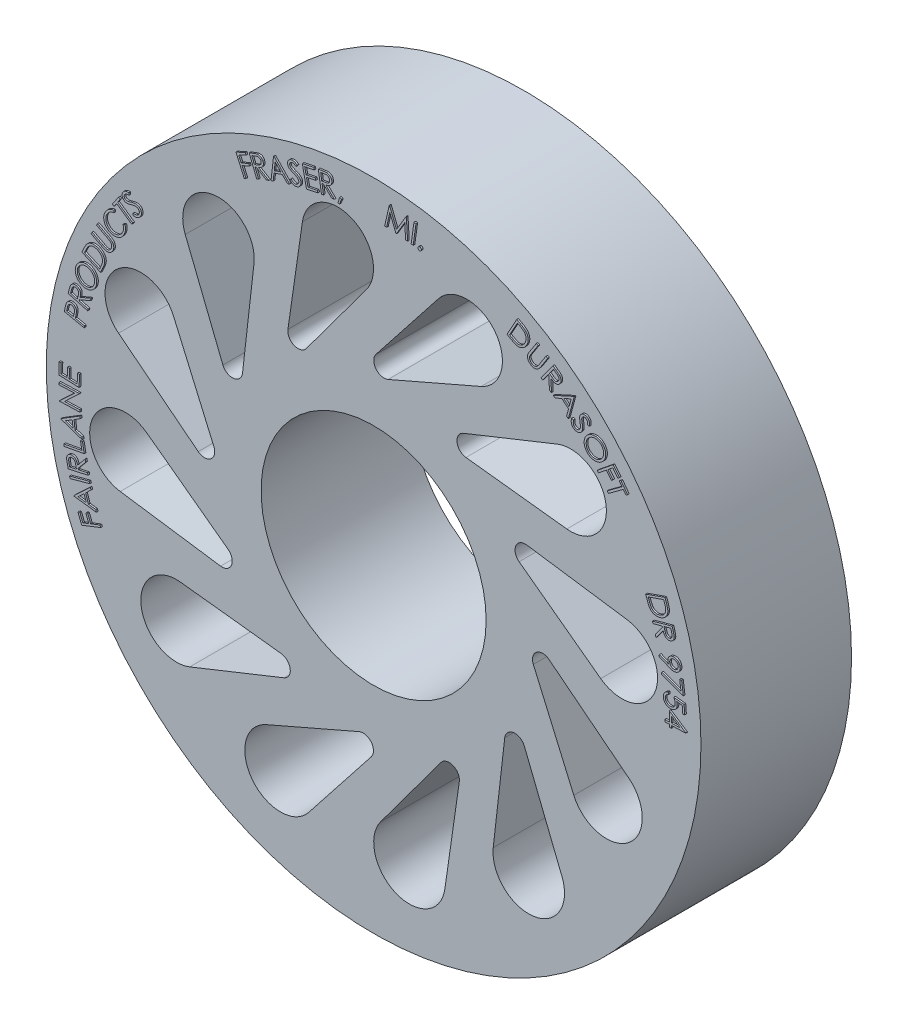
from build123d import *

# Parameters (mm, degrees)
SKETCH1_R           = 50.8
BASE_EXTRUDE_DEPTH  = 23.368
SKETCH2_R           = 17.4625
CUT_EXTRUDE1_DEPTH  = 76.546961713
CUT_EXTRUDE2_DEPTH  = 76.546961713
CIRPATTERN1_COUNT   = 12
BOSS_EXTRUDE1_DEPTH = 0.254


with BuildPart() as part:
    # Sketch1 → Base-Extrude (new body)
    with BuildSketch(Plane.XY):
        Circle(SKETCH1_R)
    extrude(amount=BASE_EXTRUDE_DEPTH)

    # Sketch2 → Cut-Extrude1 (cut, through all)
    with BuildSketch(Plane.XY.offset(23.368)):
        Circle(SKETCH2_R)
    extrude(amount=-CUT_EXTRUDE1_DEPTH, mode=Mode.SUBTRACT)

    # Sketch4 → Cut-Extrude2 (cut, through all)
    with BuildSketch(Plane.XY.offset(23.368)):
        with BuildLine():
            Line((13.297808338, -23.751241594), (11.051554965, -39.3236933))
            ThreePointArc((11.051554965, -39.3236933), (3.460437641, -43.651075956), (1.083893077, -35.242548212))
            Line((1.083893077, -35.242548212), (10.457702652, -22.57856942))
            ThreePointArc((10.457702652, -22.57856942), (12.331046403, -22.067076027), (13.297808338, -23.751241594))
        make_face()
    cut_extrude2 = extrude(amount=-CUT_EXTRUDE2_DEPTH, mode=Mode.SUBTRACT)

    # CirPattern1: Cut-Extrude2 ×12 about axis
    cirpattern1_axis = Axis((0, 0, 0), (0, 0, -1))
    for i in range(1, CIRPATTERN1_COUNT):
        add(cut_extrude2.rotate(cirpattern1_axis, i * 360 / CIRPATTERN1_COUNT), mode=Mode.SUBTRACT)

    # Sketch3 → Boss-Extrude1 (add)
    # profile 1 of 40: a face of its own
    with BuildSketch(Plane.XY.offset(23.368)):
        Polygon((48.686731705, 0.653740503), (48.688003741, 0.589502722), (46.487382747, 0.531625118), (46.497559029, 0.149378524), (46.194814638, 0.141746312), (46.184638356, 0.523992907), (45.450674013, 0.504912378), (45.442405784, 0.820377121), (46.176370127, 0.83945765), (46.137573051, 2.348091464), align=None)
        Polygon((46.479114518, 0.847089862), (47.795034991, 0.881434814), (46.454945848, 1.776311617), align=None, mode=Mode.SUBTRACT)
    # profile 2 of 40: a face of its own
    with BuildSketch(Plane.XY.offset(23.368)):
        with BuildLine():
            Line((48.535433468, 2.966161831), (48.23459713, 2.941993161))
            Line((48.23459713, 2.941993161), (48.144282627, 4.067108345))
            Line((48.144282627, 4.067108345), (47.271030424, 4.15424276))
            add(Edge.make_bspline(
                [(47.271030424, 4.15424276), (47.282972381, 4.121753047), (47.306152404, 4.058688654), (47.33169663, 3.964548818), (47.351154519, 3.87501407), (47.357584999, 3.816380594), (47.360708909, 3.787896607)],
                knots=[0, 0, 0, 0, 1.097441072, 2.13019596, 3.091654116, 4, 4, 4, 4], degree=3))
            add(Edge.make_bspline(
                [(47.360708909, 3.787896607), (47.362607949, 3.752713399), (47.366338479, 3.68359846), (47.361126583, 3.581336158), (47.346590004, 3.482887608), (47.322468569, 3.388383961), (47.288454985, 3.298006435), (47.244930858, 3.211675281), (47.191928388, 3.129490553), (47.130162763, 3.052142186), (47.061605982, 2.98048979), (46.985723291, 2.917304105), (46.904952861, 2.861489986), (46.817593096, 2.814840299), (46.724578962, 2.776832006), (46.625811091, 2.746796481), (46.521484547, 2.72501111), (46.44959709, 2.717488199), (46.413042643, 2.713662832)],
                knots=[0, 0, 0, 0, 1.052644281, 2.067845704, 3.054582081, 4.022893129, 4.977462055, 5.935369709, 6.907447471, 7.89516013, 8.89010383, 9.866201228, 10.84174305, 11.819895392, 12.820192944, 13.840543551, 14.901926141, 16, 16, 16, 16], degree=3))
            add(Edge.make_bspline(
                [(46.413042643, 2.713662832), (46.387187725, 2.712069242), (46.33614322, 2.708923068), (46.259893576, 2.709837957), (46.18506964, 2.714544011), (46.111410577, 2.725078469), (46.038959683, 2.739593116), (45.967773101, 2.758646506), (45.897813953, 2.782305891), (45.829769332, 2.810903092), (45.763675649, 2.842952021), (45.701275603, 2.879565013), (45.64206614, 2.91883306), (45.586379133, 2.961518505), (45.53466649, 3.008267154), (45.486433803, 3.058610172), (45.441126072, 3.111940999), (45.399773435, 3.168752209), (45.36202764, 3.228498019), (45.329173835, 3.291687302), (45.299866634, 3.357314385), (45.274167299, 3.425581964), (45.253283461, 3.496830594), (45.236950518, 3.570833299), (45.224009961, 3.647247802), (45.218730667, 3.699240226), (45.216057467, 3.725566879)],
                knots=[0, 0, 0, 0, 1.061592747, 2.095867268, 3.123768396, 4.132869277, 5.143615595, 6.151330734, 7.151748672, 8.168604525, 9.175307243, 10.160623809, 11.132043497, 12.086401173, 13.034087158, 13.986820934, 14.942720735, 15.90055456, 16.86510735, 17.836993468, 18.817391491, 19.810192355, 20.824966161, 21.858144626, 22.915459615, 24, 24, 24, 24], degree=3))
            add(Edge.make_bspline(
                [(45.216057467, 3.725566879), (45.214233887, 3.757145797), (45.210660039, 3.819034099), (45.214775216, 3.910773624), (45.226072151, 3.999318511), (45.24504521, 4.084773164), (45.272143356, 4.166883139), (45.306280267, 4.245863816), (45.348920706, 4.321407425), (45.398007528, 4.393587861), (45.454184932, 4.460497903), (45.514301453, 4.523034704), (45.581173916, 4.577418319), (45.651744893, 4.626731945), (45.727299843, 4.669611262), (45.807818933, 4.705824924), (45.893312055, 4.736091197), (45.952841581, 4.750500582), (45.983094726, 4.75782349)],
                knots=[0, 0, 0, 0, 1.075065081, 2.106910503, 3.117378758, 4.10734741, 5.078552708, 6.053603533, 7.028334477, 8.024165939, 9.017384351, 9.996212497, 10.969128795, 11.943059577, 12.921330025, 13.918335124, 14.942089499, 16, 16, 16, 16], degree=3))
            Line((45.983094726, 4.75782349), (46.009171449, 4.433454499))
            add(Edge.make_bspline(
                [(46.009171449, 4.433454499), (45.980520008, 4.42478423), (45.925136592, 4.408024544), (45.848752002, 4.373017757), (45.780292342, 4.334157145), (45.721721733, 4.287441561), (45.670846258, 4.234999479), (45.625622435, 4.176685175), (45.587713783, 4.110781603), (45.556390964, 4.03923068), (45.531249087, 3.964462616), (45.516297534, 3.887068812), (45.508604834, 3.808794715), (45.511160855, 3.756316117), (45.512441682, 3.730019002)],
                knots=[0, 0, 0, 0, 1.145630964, 2.21451184, 3.211996415, 4.154555746, 5.073616941, 6.006183199, 6.974432686, 7.978148612, 8.995348358, 9.989387381, 10.992478626, 12, 12, 12, 12], degree=3))
            add(Edge.make_bspline(
                [(45.512441682, 3.730019002), (45.515025876, 3.704483436), (45.520113489, 3.654210488), (45.537956146, 3.581201118), (45.562043855, 3.511455935), (45.593497442, 3.445001081), (45.631613012, 3.381563167), (45.678028167, 3.322296605), (45.731062607, 3.266103189), (45.79052485, 3.213838347), (45.8547734, 3.166063287), (45.923622098, 3.126110687), (45.99545304, 3.093395605), (46.07023321, 3.067864244), (46.148196566, 3.049427082), (46.229281116, 3.037949315), (46.313643979, 3.033921329), (46.370652994, 3.03748763), (46.399686273, 3.039303858)],
                knots=[0, 0, 0, 0, 0.982444774, 1.93418053, 2.871945095, 3.805901606, 4.746336669, 5.701809622, 6.684523061, 7.703244712, 8.731766329, 9.747503564, 10.747261472, 11.751761029, 12.77048268, 13.812518764, 14.885970021, 16, 16, 16, 16], degree=3))
            add(Edge.make_bspline(
                [(46.399686273, 3.039303858), (46.425618987, 3.04203262), (46.476543062, 3.047391091), (46.550336406, 3.062962322), (46.620378874, 3.083393668), (46.685250755, 3.112180699), (46.746941997, 3.144824972), (46.803617784, 3.184706544), (46.856301405, 3.230055744), (46.903824187, 3.281684201), (46.946108129, 3.337986972), (46.98309839, 3.398135704), (47.012001513, 3.462692461), (47.0351135, 3.530589812), (47.051816807, 3.602147766), (47.060891937, 3.677386439), (47.064533926, 3.756342364), (47.061034755, 3.809954864), (47.059236553, 3.837505982)],
                knots=[0, 0, 0, 0, 1.07219278, 2.105465125, 3.098867069, 4.067842126, 5.020184581, 5.966314952, 6.912445323, 7.875355118, 8.847074597, 9.805985695, 10.774057315, 11.750541493, 12.753471777, 13.791042936, 14.864831215, 16, 16, 16, 16], degree=3))
            add(Edge.make_bspline(
                [(47.059236553, 3.837505982), (47.056813846, 3.861295408), (47.051811976, 3.910410553), (47.037537282, 3.985202325), (47.017279175, 4.063129724), (46.993005441, 4.144547478), (46.960975553, 4.228572518), (46.925004411, 4.316391493), (46.88294497, 4.40740853), (46.851493583, 4.468340783), (46.835358348, 4.499600332)],
                knots=[0, 0, 0, 0, 0.815568425, 1.683805305, 2.594310655, 3.562195171, 4.580652829, 5.660645076, 6.799860865, 8, 8, 8, 8], degree=3))
            Line((46.835358348, 4.499600332), (48.425402419, 4.333599732))
            Line((48.425402419, 4.333599732), (48.535433468, 2.966161831))
        make_face()
    # profile 3 of 40: a face of its own
    with BuildSketch(Plane.XY.offset(23.368)):
        Polygon((48.04833456, 7.403761515), (48.316097982, 5.420022533), (44.882874825, 6.65962089), (44.980185522, 6.935016523), (47.954839969, 5.864598855), (47.752586363, 7.363692404), align=None)
    # profile 4 of 40: a face of its own
    with BuildSketch(Plane.XY.offset(23.368)):
        with BuildLine():
            Line((44.500213963, 8.850445514), (44.616605189, 9.136653447))
            Line((44.616605189, 9.136653447), (46.043828747, 8.541976964))
            add(Edge.make_bspline(
                [(46.043828747, 8.541976964), (46.030288408, 8.567864874), (46.003749535, 8.618604811), (45.97158078, 8.696065927), (45.946104721, 8.772126594), (45.934856765, 8.822983128), (45.929345574, 8.847901444)],
                knots=[0, 0, 0, 0, 1.068796831, 2.094826627, 3.066516953, 4, 4, 4, 4], degree=3))
            add(Edge.make_bspline(
                [(45.929345574, 8.847901444), (45.924196022, 8.878141443), (45.914018274, 8.937908796), (45.911050927, 9.027710213), (45.914798537, 9.115548952), (45.929291292, 9.201417146), (45.952052741, 9.285452255), (45.984255798, 9.367763189), (46.025832614, 9.447610421), (46.075163743, 9.525090921), (46.132093827, 9.597460594), (46.194379452, 9.664244454), (46.262969335, 9.722837205), (46.336420866, 9.774593198), (46.41503472, 9.819543861), (46.499505386, 9.856414154), (46.589458034, 9.885828037), (46.65193334, 9.899361552), (46.683662481, 9.906234777)],
                knots=[0, 0, 0, 0, 1.015503481, 2.00707526, 2.970901906, 3.92499918, 4.886312851, 5.851828222, 6.84796971, 7.86536729, 8.891389392, 9.895404078, 10.886876282, 11.875181752, 12.869537594, 13.882558832, 14.924621707, 16, 16, 16, 16], degree=3))
            add(Edge.make_bspline(
                [(46.683662481, 9.906234777), (46.727434029, 9.913180457), (46.813561061, 9.926847114), (46.943101249, 9.926075009), (47.068854063, 9.909755689), (47.190177244, 9.876474056), (47.305695872, 9.827302616), (47.41398714, 9.763004723), (47.512816554, 9.681921274), (47.602345574, 9.587942367), (47.680204345, 9.48274891), (47.744624305, 9.369473044), (47.793195446, 9.248291748), (47.812439886, 9.16347726), (47.822134035, 9.120753006)],
                knots=[0, 0, 0, 0, 1.033925331, 2.034401845, 3.013665133, 3.989314521, 4.963529703, 5.938650944, 6.921028035, 7.940462081, 8.963738984, 9.970631185, 10.977730449, 12, 12, 12, 12], degree=3))
            add(Edge.make_bspline(
                [(47.822134035, 9.120753006), (47.828882761, 9.078460414), (47.842257058, 8.994647003), (47.840476804, 8.867882527), (47.824208337, 8.743006355), (47.790851715, 8.621479002), (47.743401741, 8.504880373), (47.678267923, 8.397806335), (47.600713035, 8.298620602), (47.507532483, 8.211919256), (47.40507863, 8.13610483), (47.294224603, 8.074899349), (47.177062456, 8.02725244), (47.095065924, 8.008333452), (47.05382474, 7.99881791)],
                knots=[0, 0, 0, 0, 1.016989494, 2.015420539, 3.0024151, 4.005457742, 5.004652503, 5.986183273, 6.976880619, 7.989912063, 9.003508097, 10.001174842, 10.994665814, 12, 12, 12, 12], degree=3))
            add(Edge.make_bspline(
                [(47.05382474, 7.99881791), (47.021244637, 7.993728763), (46.954883967, 7.983362952), (46.852177717, 7.979638851), (46.745652529, 7.984183939), (46.633458495, 7.997731291), (46.512521259, 8.023132802), (46.380511547, 8.063237964), (46.234105424, 8.113792397), (46.1336956, 8.155938122), (46.080717769, 8.178174881)],
                knots=[0, 0, 0, 0, 0.7873205, 1.603651022, 2.450347429, 3.333127369, 4.300774452, 5.398792998, 6.627561535, 8, 8, 8, 8], degree=3))
            Line((46.080717769, 8.178174881), (44.500213963, 8.850445514))
        make_face()
        with BuildLine():
            add(Edge.make_bspline(
                [(46.214281471, 8.827548879), (46.219182231, 8.80539574), (46.228820839, 8.761825875), (46.249955866, 8.699106254), (46.276870221, 8.6400996), (46.309396999, 8.58478747), (46.347042259, 8.532774466), (46.390590773, 8.48507194), (46.439382973, 8.44080497), (46.492914814, 8.400747615), (46.549582928, 8.364872473), (46.609088914, 8.336768053), (46.669134482, 8.312982553), (46.730967831, 8.297480406), (46.793995003, 8.287653118), (46.858348522, 8.284677175), (46.92421127, 8.287614816), (46.96801354, 8.294759555), (46.990222978, 8.298382213)],
                knots=[0, 0, 0, 0, 1.041986234, 2.049334798, 3.034536942, 4.016941718, 4.993144626, 5.979357653, 6.979331124, 8.015838469, 9.048447344, 10.054900551, 11.035468241, 12.011282223, 12.977076564, 13.962182379, 14.966748012, 16, 16, 16, 16], degree=3))
            add(Edge.make_bspline(
                [(46.990222978, 8.298382213), (47.012152801, 8.303314592), (47.055477892, 8.313059121), (47.117925881, 8.333835134), (47.176310703, 8.361309448), (47.23184458, 8.392526798), (47.283116619, 8.430776443), (47.330783822, 8.474039813), (47.375110696, 8.522656442), (47.414408881, 8.576591625), (47.450371509, 8.633027744), (47.478612597, 8.692711668), (47.502104001, 8.75307309), (47.517864554, 8.815261153), (47.527456841, 8.878526991), (47.530793278, 8.943107186), (47.526710898, 9.009131527), (47.519752825, 9.053169987), (47.516209556, 9.075595754)],
                knots=[0, 0, 0, 0, 1.033033648, 2.040886297, 3.017723583, 3.995727127, 4.964557415, 5.95126395, 6.951737814, 7.982930703, 9.016056303, 10.023013145, 11.013179458, 11.989481745, 12.965394755, 13.950993524, 14.956581544, 16, 16, 16, 16], degree=3))
            add(Edge.make_bspline(
                [(47.516209556, 9.075595754), (47.511288153, 9.097530888), (47.501565311, 9.140866469), (47.480569867, 9.203421114), (47.453643181, 9.262083225), (47.421840882, 9.317303382), (47.383839359, 9.368496501), (47.340572738, 9.416191814), (47.291730455, 9.460416547), (47.238229091, 9.500521982), (47.181653022, 9.536147619), (47.122395019, 9.5648077), (47.062319449, 9.587964906), (47.000420221, 9.603959952), (46.937537727, 9.613470234), (46.873207066, 9.616586424), (46.807550613, 9.613612227), (46.763749125, 9.606473817), (46.741540085, 9.602854368)],
                knots=[0, 0, 0, 0, 1.035094135, 2.044957045, 3.032618256, 4.004117533, 4.974880248, 5.963554867, 6.966024274, 8.005118744, 9.040305015, 10.040488504, 11.032629801, 12.001425616, 12.979285182, 13.95709598, 14.964169012, 16, 16, 16, 16], degree=3))
            add(Edge.make_bspline(
                [(46.741540085, 9.602854368), (46.719604951, 9.597932966), (46.676269368, 9.588210124), (46.613714736, 9.567214674), (46.555052575, 9.540288011), (46.499832602, 9.508485628), (46.448638794, 9.470484419), (46.400946112, 9.4272166), (46.356711266, 9.37837892), (46.316644965, 9.324859744), (46.280772227, 9.268188226), (46.252667184, 9.208683124), (46.228881845, 9.148637327), (46.213379655, 9.086804039), (46.203552379, 9.023776851), (46.200576433, 8.959423336), (46.203514075, 8.893560587), (46.210658814, 8.849758317), (46.214281471, 8.827548879)],
                knots=[0, 0, 0, 0, 1.034498732, 2.043780751, 3.030873843, 4.001814297, 4.972018613, 5.960124529, 6.9620173, 8.000514065, 9.035104879, 10.043489822, 11.025939565, 12.003626476, 12.971274514, 13.958271093, 14.964764839, 16, 16, 16, 16], degree=3))
        make_face(mode=Mode.SUBTRACT)
    # profile 5 of 40: a face of its own
    with BuildSketch(Plane.XY.offset(23.368)):
        with BuildLine():
            Line((46.573037297, 13.926933119), (46.740945951, 13.321444336))
            add(Edge.make_bspline(
                [(46.740945951, 13.321444336), (46.752119028, 13.280990788), (46.773545706, 13.203412772), (46.801914311, 13.091553732), (46.826887647, 12.98961297), (46.848100242, 12.897470931), (46.864782516, 12.814985789), (46.876783379, 12.742402287), (46.885609279, 12.679868544), (46.888467208, 12.641347727), (46.889774076, 12.623732998)],
                knots=[0, 0, 0, 0, 1.409781286, 2.703546189, 3.876402111, 4.935474067, 5.879647634, 6.70273565, 7.406789317, 8, 8, 8, 8], degree=3))
            add(Edge.make_bspline(
                [(46.889774076, 12.623732998), (46.8904318, 12.59997816), (46.891731327, 12.553043514), (46.885914371, 12.483580428), (46.877010058, 12.416028029), (46.861384667, 12.35051543), (46.84051756, 12.28711127), (46.814028815, 12.225568699), (46.783077609, 12.165856637), (46.746782192, 12.108555136), (46.705647157, 12.05456448), (46.659435698, 12.00476149), (46.609431574, 11.958964295), (46.554750789, 11.917779816), (46.495422525, 11.881595809), (46.431699211, 11.849976682), (46.363799777, 11.822068474), (46.316227991, 11.807944119), (46.291917505, 11.800726187)],
                knots=[0, 0, 0, 0, 1.031923352, 2.038867043, 3.025199589, 3.99061289, 4.960806254, 5.922563757, 6.899210033, 7.880711393, 8.866570497, 9.844563003, 10.829345253, 11.809635096, 12.814595823, 13.844666714, 14.898565663, 16, 16, 16, 16], degree=3))
            add(Edge.make_bspline(
                [(46.291917505, 11.800726187), (46.251414615, 11.790925366), (46.172209466, 11.771759436), (46.05195354, 11.762248458), (45.935305127, 11.770056194), (45.822633276, 11.793331535), (45.715889538, 11.83350677), (45.616569526, 11.890324911), (45.525843669, 11.963370265), (45.456549158, 12.035605433), (45.406521562, 12.102888775), (45.36968603, 12.159671745), (45.333876568, 12.222137233), (45.300377993, 12.290872655), (45.268758684, 12.365835283), (45.237511971, 12.446265688), (45.208251558, 12.532856542), (45.190945154, 12.592919778), (45.182066744, 12.623732998)],
                knots=[0, 0, 0, 0, 1.271794385, 2.48704876, 3.668582764, 4.833611013, 5.989835418, 7.138814806, 8.314384889, 9.53781269, 10.18560066, 10.873751525, 11.604920226, 12.384233654, 13.208453163, 14.090254165, 15.020275572, 16, 16, 16, 16], degree=3))
            Line((45.182066744, 12.623732998), (44.070943948, 11.138631836))
            Line((44.070943948, 11.138631836), (43.967273074, 11.514518255))
            Line((43.967273074, 11.514518255), (45.078395871, 12.997711364))
            Line((45.078395871, 12.997711364), (45.030058531, 13.171344176))
            Line((45.030058531, 13.171344176), (43.616191344, 12.779557317))
            Line((43.616191344, 12.779557317), (43.532237017, 13.083573744))
            Line((43.532237017, 13.083573744), (46.573037297, 13.926933119))
        make_face()
        with BuildLine():
            Line((46.359335374, 13.540234401), (45.325806728, 13.25339045))
            Line((45.325806728, 13.25339045), (45.466366624, 12.729311925))
            add(Edge.make_bspline(
                [(45.466366624, 12.729311925), (45.473492969, 12.70490753), (45.487291124, 12.657655307), (45.508606438, 12.589612246), (45.531000356, 12.527367066), (45.553139484, 12.470372806), (45.576041398, 12.418792738), (45.599282554, 12.37232287), (45.623478449, 12.331638217), (45.655263551, 12.284998342), (45.699814708, 12.235874924), (45.758860547, 12.1856512), (45.82508965, 12.146833773), (45.896663549, 12.118034843), (45.971967106, 12.100385506), (46.049097965, 12.093948841), (46.1271692, 12.098926997), (46.17819481, 12.110792172), (46.204147073, 12.116826949)],
                knots=[0, 0, 0, 0, 1.116756524, 2.162283831, 3.131360486, 4.021954053, 4.847407017, 5.609550125, 6.302686734, 6.925229417, 8.086040413, 9.20326277, 10.318037332, 11.442069724, 12.580514359, 13.701881836, 14.8311484, 16, 16, 16, 16], degree=3))
            add(Edge.make_bspline(
                [(46.204147073, 12.116826949), (46.228790693, 12.12484815), (46.277538859, 12.140715091), (46.345511033, 12.176061012), (46.406746881, 12.221251407), (46.460478242, 12.27529613), (46.506081829, 12.335768124), (46.54162317, 12.401340697), (46.566056549, 12.470886346), (46.577362778, 12.532360923), (46.580641102, 12.58532156), (46.579820541, 12.630381064), (46.575742409, 12.680461736), (46.56892073, 12.73571113), (46.557486402, 12.795990843), (46.544674654, 12.861521866), (46.526808724, 12.931675712), (46.514128232, 12.980124081), (46.507527481, 13.005343575)],
                knots=[0, 0, 0, 0, 1.160045675, 2.29471554, 3.415938887, 4.558102853, 5.698289044, 6.799362689, 7.887196986, 8.988598552, 9.588401635, 10.263078707, 11.006389162, 11.839605354, 12.756591232, 13.755384646, 14.831579555, 16, 16, 16, 16], degree=3))
            Line((46.507527481, 13.005343575), (46.359335374, 13.540234401))
        make_face(mode=Mode.SUBTRACT)
    # profile 6 of 40: a face of its own
    with BuildSketch(Plane.XY.offset(23.368)):
        with BuildLine():
            Line((42.476961026, 16.179360817), (45.459247685, 17.223701762))
            Line((45.459247685, 17.223701762), (45.675493678, 16.605492628))
            add(Edge.make_bspline(
                [(45.675493678, 16.605492628), (45.693953544, 16.551507058), (45.729596026, 16.447271211), (45.777395922, 16.295515805), (45.8175436, 16.154011605), (45.851080752, 16.022873293), (45.876713085, 15.901716989), (45.894438747, 15.790904304), (45.906449888, 15.690529115), (45.90768918, 15.626903083), (45.90827613, 15.596768669)],
                knots=[0, 0, 0, 0, 1.317383121, 2.543615722, 3.67328645, 4.713351765, 5.668639073, 6.53138032, 7.30443577, 8, 8, 8, 8], degree=3))
            add(Edge.make_bspline(
                [(45.90827613, 15.596768669), (45.907433258, 15.556663687), (45.905769478, 15.477498834), (45.892155729, 15.360448103), (45.869244411, 15.247093638), (45.837298883, 15.137108225), (45.796386041, 15.030563036), (45.746839657, 14.927136379), (45.68733697, 14.827736114), (45.61908372, 14.732582543), (45.543810966, 14.641430778), (45.459910754, 14.556870071), (45.369582675, 14.477714224), (45.271616855, 14.405000088), (45.166665429, 14.338150142), (45.054184926, 14.277940519), (44.935269642, 14.222676074), (44.852087493, 14.192072302), (44.809873686, 14.176541305)],
                knots=[0, 0, 0, 0, 1.000652544, 1.97522866, 2.936064423, 3.883758328, 4.829988978, 5.781279681, 6.742188277, 7.717037224, 8.701330761, 9.68903115, 10.686461424, 11.695956841, 12.730716653, 13.788895945, 14.87789484, 16, 16, 16, 16], degree=3))
            add(Edge.make_bspline(
                [(44.809873686, 14.176541305), (44.772919523, 14.1641787), (44.700063853, 14.139805643), (44.589646214, 14.11218038), (44.480749857, 14.090933587), (44.372841477, 14.076910488), (44.266192963, 14.069628363), (44.160579087, 14.070526972), (44.056389759, 14.077790836), (43.954035015, 14.09334567), (43.854714849, 14.114947561), (43.758815339, 14.141577604), (43.667133261, 14.173894601), (43.579925799, 14.212255326), (43.496798097, 14.255407215), (43.41825893, 14.304747057), (43.343734229, 14.359436472), (43.272939647, 14.420283776), (43.206115145, 14.489420003), (43.142079301, 14.567149784), (43.079982216, 14.654129648), (43.021258676, 14.751244059), (42.963903546, 14.857473406), (42.909568879, 14.973359475), (42.857086875, 15.098536176), (42.825336197, 15.185969018), (42.808962228, 15.231058533)],
                knots=[0, 0, 0, 0, 1.088552806, 2.146097699, 3.1778562, 4.187521756, 5.18494637, 6.162484645, 7.136678071, 8.101040325, 9.052726548, 9.975559406, 10.8805923, 11.766656388, 12.635823616, 13.495530514, 14.355788382, 15.216861853, 16.100863757, 17.039179285, 18.0288321, 19.084516812, 20.208414403, 21.400964327, 22.659665475, 24, 24, 24, 24], degree=3))
            Line((42.808962228, 15.231058533), (42.476961026, 16.179360817))
        make_face()
        with BuildLine():
            Line((42.858571603, 15.992371634), (42.979414952, 15.647650079))
            add(Edge.make_bspline(
                [(42.979414952, 15.647650079), (42.997045476, 15.598187862), (43.030897268, 15.503217078), (43.082396839, 15.367706182), (43.131939714, 15.244896706), (43.179301753, 15.134564524), (43.225870956, 15.037121187), (43.269983969, 14.95203925), (43.312062755, 14.879251657), (43.342478002, 14.837155696), (43.356573406, 14.817647075)],
                knots=[0, 0, 0, 0, 1.378079591, 2.646005502, 3.804233594, 4.853362734, 5.796582701, 6.637754742, 7.368691745, 8, 8, 8, 8], degree=3))
            add(Edge.make_bspline(
                [(43.356573406, 14.817647075), (43.375655725, 14.79353541), (43.413452114, 14.745777386), (43.476902016, 14.681329302), (43.543166606, 14.622057088), (43.614017734, 14.569934706), (43.688693283, 14.524021889), (43.767190947, 14.484073691), (43.850181571, 14.452243141), (43.936038691, 14.425083286), (44.024986762, 14.405478928), (44.116266004, 14.393310238), (44.209439252, 14.389149337), (44.30449179, 14.39151062), (44.401175266, 14.401999399), (44.499769034, 14.419325878), (44.600191129, 14.443849181), (44.666701554, 14.46608517), (44.700478654, 14.477377644)],
                knots=[0, 0, 0, 0, 0.989857778, 1.960613308, 2.908887564, 3.851364941, 4.789576794, 5.730270957, 6.683964598, 7.649517291, 8.628787544, 9.613969584, 10.612202518, 11.630144799, 12.673943771, 13.741708243, 14.853133942, 16, 16, 16, 16], degree=3))
            add(Edge.make_bspline(
                [(44.700478654, 14.477377644), (44.735623072, 14.490535632), (44.80462314, 14.516369099), (44.903718319, 14.561522593), (44.996134153, 14.612773372), (45.082808013, 14.668354943), (45.16272258, 14.729961283), (45.236716592, 14.796274104), (45.30501861, 14.867339211), (45.366124789, 14.943896664), (45.419937574, 15.024447022), (45.46678852, 15.108131855), (45.505670122, 15.194987205), (45.537010089, 15.284718466), (45.559906117, 15.377605147), (45.575024863, 15.473334458), (45.583171486, 15.572256783), (45.581549642, 15.639158564), (45.580727052, 15.673090785)],
                knots=[0, 0, 0, 0, 1.125934296, 2.210579931, 3.264162451, 4.294731639, 5.297451866, 6.288621572, 7.274078201, 8.251761977, 9.22400733, 10.178098697, 11.126381655, 12.07605079, 13.02655066, 13.992992011, 14.982056431, 16, 16, 16, 16], degree=3))
            add(Edge.make_bspline(
                [(45.580727052, 15.673090785), (45.57899848, 15.700691483), (45.575314387, 15.759516653), (45.560910327, 15.85259628), (45.541214725, 15.956116808), (45.515007838, 16.070072805), (45.481636197, 16.194294992), (45.441369956, 16.328838522), (45.39497568, 16.473894218), (45.360651376, 16.57354614), (45.342856459, 16.625209174)],
                knots=[0, 0, 0, 0, 0.674014133, 1.436521508, 2.294245677, 3.243540701, 4.286809973, 5.43010073, 6.66767455, 8, 8, 8, 8], degree=3))
            Line((45.342856459, 16.625209174), (45.269078414, 16.836367027))
            Line((45.269078414, 16.836367027), (42.858571603, 15.992371634))
        make_face(mode=Mode.SUBTRACT)
    # profile 7 of 40: a face of its own
    with BuildSketch(Plane.XY.offset(23.368)):
        Polygon((38.386778064, 29.343032593), (38.633552903, 29.524933635), (39.662629426, 28.129510958), (39.415854586, 27.947609917), (38.997354987, 28.514937641), (36.700695331, 26.821858715), (36.509254025, 27.081353907), (38.805913681, 28.774432833), align=None)
    # profile 8 of 40: a face of its own
    with BuildSketch(Plane.XY.offset(23.368)):
        Polygon((37.415897108, 31.038234902), (38.409356643, 29.807540792), (38.167669944, 29.61228338), (37.370739856, 30.599382739), (36.602430561, 29.979265551), (37.399360649, 28.992166192), (37.15767395, 28.797544798), (36.360743862, 29.784644157), (35.156762492, 28.812809221), (34.960233045, 29.056403973), align=None)
    # profile 9 of 40: a face of its own
    with BuildSketch(Plane.XY.offset(23.368)):
        with BuildLine():
            add(Edge.make_bspline(
                [(35.813531957, 32.974737579), (35.852361812, 32.930498238), (35.928773549, 32.843441386), (36.026704141, 32.702480856), (36.10950525, 32.557318519), (36.175066901, 32.406789432), (36.226062, 32.252176117), (36.259866267, 32.092208247), (36.276535141, 31.927436042), (36.278600061, 31.759873757), (36.26472223, 31.593336543), (36.235708587, 31.4312814), (36.190188665, 31.275974069), (36.129498092, 31.126988516), (36.053375343, 30.984400218), (35.961653088, 30.848550387), (35.855523074, 30.718221429), (35.773697698, 30.639729836), (35.732121701, 30.599847755)],
                knots=[0, 0, 0, 0, 1.064689103, 2.095159612, 3.100379173, 4.084945263, 5.061786555, 6.042419025, 7.037835209, 8.054770816, 9.071315407, 10.058055091, 11.029492644, 11.995031217, 12.964951846, 13.949398286, 14.958076151, 16, 16, 16, 16], degree=3))
            add(Edge.make_bspline(
                [(35.732121701, 30.599847755), (35.689117168, 30.562338367), (35.604426195, 30.488469253), (35.467417643, 30.393371192), (35.32484137, 30.314007225), (35.176822149, 30.250037567), (35.023340479, 30.202063865), (34.864499552, 30.170277443), (34.700278228, 30.153909378), (34.532707412, 30.152621006), (34.365722624, 30.16704172), (34.203690124, 30.197047603), (34.047832814, 30.241351892), (33.899219412, 30.30255501), (33.756332777, 30.377500338), (33.621446857, 30.469433413), (33.492277913, 30.575182366), (33.414124226, 30.65605615), (33.374404353, 30.697158452)],
                knots=[0, 0, 0, 0, 1.041594063, 2.051263218, 3.03922782, 4.017424584, 4.99102025, 5.970595426, 6.970776204, 8.000754623, 9.026831939, 10.027012717, 11.006166918, 11.980447593, 12.957333066, 13.947480448, 14.956852584, 16, 16, 16, 16], degree=3))
            add(Edge.make_bspline(
                [(33.374404353, 30.697158452), (33.336421447, 30.740554611), (33.261497782, 30.826156256), (33.165890309, 30.964894194), (33.084391529, 31.107859792), (33.021180462, 31.257210144), (32.971317634, 31.410849568), (32.939066149, 31.570256347), (32.922787065, 31.734512862), (32.921420537, 31.901879115), (32.935996569, 32.068375213), (32.965264617, 32.230222955), (33.008861744, 32.38537037), (33.068634987, 32.533426188), (33.143340577, 32.674473815), (33.233079519, 32.808471738), (33.336835726, 32.93630773), (33.416599369, 33.013267615), (33.457086645, 33.05233173)],
                knots=[0, 0, 0, 0, 1.054131975, 2.079341453, 3.076003862, 4.059275308, 5.040410844, 6.026072981, 7.02779999, 8.055492839, 9.083156421, 10.080369429, 11.059970981, 12.025657031, 12.995383627, 13.974140463, 14.97169273, 16, 16, 16, 16], degree=3))
            add(Edge.make_bspline(
                [(33.457086645, 33.05233173), (33.485362447, 33.077551222), (33.541432396, 33.127560613), (33.631094499, 33.194824254), (33.723381943, 33.256161631), (33.818888943, 33.31075867), (33.917299381, 33.359520543), (34.018870433, 33.401402491), (34.123878652, 33.436519785), (34.231377942, 33.46499452), (34.340187912, 33.48633954), (34.448883405, 33.501424203), (34.557291594, 33.508200561), (34.66520495, 33.508247031), (34.772546467, 33.501391629), (34.879239744, 33.486645581), (34.98539431, 33.464182921), (35.090848626, 33.435132525), (35.193948683, 33.398828289), (35.29421457, 33.357025411), (35.390278559, 33.308412709), (35.48288538, 33.254351216), (35.571551791, 33.193809277), (35.656021676, 33.126508926), (35.738044027, 33.05455014), (35.78827952, 33.001436704), (35.813531957, 32.974737579)],
                knots=[0, 0, 0, 0, 1.039556696, 2.061405353, 3.073347383, 4.079500559, 5.078832279, 6.085994602, 7.092568379, 8.115890622, 9.136147407, 10.134411184, 11.125730906, 12.114981868, 13.09468792, 14.075654733, 15.068561564, 16.070938281, 17.07577805, 18.066824465, 19.050531727, 20.028594628, 21.008317961, 21.994380382, 22.991812746, 24, 24, 24, 24], degree=3))
        make_face()
        with BuildLine():
            add(Edge.make_bspline(
                [(35.594741893, 32.752767427), (35.574669059, 32.773825988), (35.534595514, 32.815867444), (35.469583883, 32.873769031), (35.400708265, 32.92626834), (35.329185359, 32.97509591), (35.254062771, 33.01908072), (35.175134561, 33.057817632), (35.09277902, 33.09144233), (35.007870024, 33.120661724), (34.921215497, 33.144658567), (34.833983641, 33.163408325), (34.746585949, 33.175320603), (34.659275448, 33.181790042), (34.571746927, 33.182328299), (34.484155704, 33.177512419), (34.396674401, 33.165704955), (34.309729768, 33.148755263), (34.224019884, 33.125625341), (34.139596182, 33.097963811), (34.057809513, 33.063333674), (33.977719362, 33.023651723), (33.899844141, 32.978797443), (33.824073467, 32.927917339), (33.750506209, 32.87168035), (33.703824721, 32.830233945), (33.680328832, 32.809372996)],
                knots=[0, 0, 0, 0, 0.983109769, 1.962687161, 2.938798312, 3.908760796, 4.888338187, 5.878656423, 6.878085556, 7.893369519, 8.91221328, 9.915744756, 10.906918267, 11.891307023, 12.873109986, 13.863713396, 14.853927911, 15.854589513, 16.855841136, 17.852955284, 18.855129719, 19.855046886, 20.872806354, 21.890439667, 22.938208753, 24, 24, 24, 24], degree=3))
            add(Edge.make_bspline(
                [(33.680328832, 32.809372996), (33.647046973, 32.777113216), (33.581526843, 32.713605195), (33.495502124, 32.609334261), (33.421706396, 32.499893682), (33.360309842, 32.385098842), (33.31184175, 32.264738792), (33.275407507, 32.139250513), (33.251122049, 32.00844915), (33.240265217, 31.873815237), (33.240387628, 31.739033368), (33.254068863, 31.607034346), (33.279019416, 31.479423311), (33.31794552, 31.356791013), (33.367299608, 31.238016339), (33.430949505, 31.124824078), (33.506276379, 31.015681663), (33.564756755, 30.948281611), (33.594466452, 30.914040464)],
                knots=[0, 0, 0, 0, 1.052795819, 2.072580112, 3.06551112, 4.048454638, 5.025522995, 6.009045017, 7.013633559, 8.043600374, 9.074738656, 10.072463051, 11.055217596, 12.024460883, 12.991846013, 13.973241244, 14.970348808, 16, 16, 16, 16], degree=3))
            add(Edge.make_bspline(
                [(33.594466452, 30.914040464), (33.615614254, 30.891936829), (33.657520096, 30.848136935), (33.724635369, 30.787536768), (33.794645362, 30.732246401), (33.867377558, 30.681692122), (33.943235188, 30.636398448), (34.022461826, 30.596448814), (34.104210346, 30.560565219), (34.188990037, 30.531016176), (34.274675813, 30.506114476), (34.361216051, 30.4876932), (34.44764524, 30.474728821), (34.534393036, 30.468540805), (34.621275482, 30.467928612), (34.708236179, 30.472757573), (34.795285195, 30.484616605), (34.88200753, 30.501559302), (34.9678576, 30.524481536), (35.051876042, 30.552973823), (35.13345978, 30.587699604), (35.213266605, 30.627108478), (35.290944195, 30.672208243), (35.365949278, 30.723553392), (35.439613941, 30.779351626), (35.486037598, 30.820649031), (35.509515531, 30.841534454)],
                knots=[0, 0, 0, 0, 1.029816701, 2.040653583, 3.041840189, 4.031970973, 5.021200619, 6.0141069, 7.018038438, 8.025036429, 9.035041107, 10.020761372, 11.002077261, 11.975572114, 12.946472199, 13.926150849, 14.905491317, 15.902316322, 16.899729086, 17.895300754, 18.887051521, 19.883134946, 20.890815913, 21.908536322, 22.942279724, 24, 24, 24, 24], degree=3))
            add(Edge.make_bspline(
                [(35.509515531, 30.841534454), (35.532077271, 30.862860964), (35.576898132, 30.905227932), (35.638138155, 30.973356379), (35.694695449, 31.043660892), (35.745390637, 31.116616774), (35.790740524, 31.192097558), (35.831066609, 31.269688698), (35.865290579, 31.350193616), (35.894683262, 31.4327417), (35.918058001, 31.517166361), (35.935881376, 31.602565698), (35.948288081, 31.688585078), (35.953527234, 31.775336024), (35.954565079, 31.862846657), (35.948846185, 31.951089665), (35.936157665, 32.039939364), (35.919590099, 32.129091428), (35.896299854, 32.217026578), (35.869622581, 32.303008728), (35.836040442, 32.385458185), (35.797655132, 32.464892094), (35.755631596, 32.542259361), (35.706417085, 32.615204429), (35.654159403, 32.686569599), (35.614630698, 32.730609048), (35.594741893, 32.752767427)],
                knots=[0, 0, 0, 0, 1.049486672, 2.084896557, 3.094824956, 4.099165067, 5.086472482, 6.070860251, 7.053654208, 8.042288248, 9.032013466, 10.013446719, 10.990839083, 11.967994774, 12.950213278, 13.9488309, 14.954628486, 15.983864493, 17.01327527, 18.029039547, 19.0261892, 20.020241305, 21.011834323, 22.000078364, 22.993742597, 24, 24, 24, 24], degree=3))
        make_face(mode=Mode.SUBTRACT)
    # profile 10 of 40: a face of its own
    with BuildSketch(Plane.XY.offset(23.368)):
        with BuildLine():
            Line((30.983703542, 34.06914017), (31.288992004, 34.001086283))
            add(Edge.make_bspline(
                [(31.288992004, 34.001086283), (31.277295891, 33.955264159), (31.254944203, 33.867696446), (31.236737862, 33.738965856), (31.229982848, 33.620062234), (31.237505084, 33.510699677), (31.256959325, 33.410602389), (31.292171194, 33.321142759), (31.338827396, 33.240169553), (31.381105542, 33.195779054), (31.402203141, 33.173627349)],
                knots=[0, 0, 0, 0, 1.292939545, 2.470853533, 3.55095481, 4.545229921, 5.463221964, 6.328153671, 7.165716854, 8, 8, 8, 8], degree=3))
            add(Edge.make_bspline(
                [(31.402203141, 33.173627349), (31.421722615, 33.156357039), (31.460422, 33.122116856), (31.52545368, 33.080150547), (31.59474736, 33.045986151), (31.66785831, 33.020887248), (31.742599522, 33.004848552), (31.816627287, 32.998926619), (31.889021983, 33.003356776), (31.958768522, 33.018033218), (32.02505882, 33.04185311), (32.087249907, 33.072778173), (32.143769028, 33.112622821), (32.17682907, 33.144356277), (32.193409071, 33.160270979)],
                knots=[0, 0, 0, 0, 1.065393779, 2.112253837, 3.156089115, 4.220740668, 5.267313029, 6.276830649, 7.250512984, 8.225586073, 9.183365393, 10.126291452, 11.060313079, 12, 12, 12, 12], degree=3))
            add(Edge.make_bspline(
                [(32.193409071, 33.160270979), (32.210752835, 33.18026378), (32.245622992, 33.220459907), (32.283957988, 33.292497586), (32.314230693, 33.371872382), (32.324313757, 33.42905549), (32.329516843, 33.458563247)],
                knots=[0, 0, 0, 0, 0.951023396, 1.912061055, 2.92257701, 4, 4, 4, 4], degree=3))
            add(Edge.make_bspline(
                [(32.329516843, 33.458563247), (32.332365191, 33.480796395), (32.338371031, 33.527675746), (32.341437166, 33.602060713), (32.342208474, 33.683732691), (32.339053015, 33.772461481), (32.330866002, 33.86826886), (32.320026603, 33.971106267), (32.306331698, 34.08148816), (32.293950508, 34.15716115), (32.28753968, 34.196343695)],
                knots=[0, 0, 0, 0, 0.725131243, 1.528963905, 2.407243303, 3.368444504, 4.400934959, 5.518576797, 6.715149533, 8, 8, 8, 8], degree=3))
            add(Edge.make_bspline(
                [(32.28753968, 34.196343695), (32.281285821, 34.235336346), (32.269367514, 34.309646695), (32.253954708, 34.416279484), (32.241871521, 34.512548995), (32.232758136, 34.59883642), (32.226874271, 34.674981519), (32.224244724, 34.740949548), (32.224220106, 34.796848093), (32.227526185, 34.830466147), (32.229026058, 34.845717694)],
                knots=[0, 0, 0, 0, 1.450198406, 2.763719509, 3.956311091, 5.012977889, 5.94985092, 6.760132163, 7.437507531, 8, 8, 8, 8], degree=3))
            add(Edge.make_bspline(
                [(32.229026058, 34.845717694), (32.232345269, 34.868450541), (32.238867852, 34.913122875), (32.253433218, 34.978534004), (32.273190615, 35.040816183), (32.297555242, 35.100308279), (32.32610438, 35.157334214), (32.360028247, 35.211028761), (32.39752263, 35.262766834), (32.42629608, 35.294162904), (32.440819928, 35.310010562)],
                knots=[0, 0, 0, 0, 1.061172766, 2.085311323, 3.09206632, 4.076075566, 5.052892704, 6.034021656, 7.007641669, 8, 8, 8, 8], degree=3))
            add(Edge.make_bspline(
                [(32.440819928, 35.310010562), (32.464795184, 35.333623709), (32.511982409, 35.380098245), (32.592772648, 35.436791573), (32.678466845, 35.482605183), (32.76972556, 35.515714814), (32.864334699, 35.535801953), (32.960819814, 35.544036512), (33.058413176, 35.537091182), (33.155935431, 35.517534286), (33.250970182, 35.484784782), (33.342037708, 35.44177369), (33.427019854, 35.385772081), (33.477844763, 35.340559026), (33.503605385, 35.317642774)],
                knots=[0, 0, 0, 0, 1.020070366, 2.007665368, 2.983679051, 3.96299753, 4.943837544, 5.912331437, 6.892727914, 7.903763621, 8.923448139, 9.936755173, 10.95424367, 12, 12, 12, 12], degree=3))
            add(Edge.make_bspline(
                [(33.503605385, 35.317642774), (33.529209181, 35.291613431), (33.580138133, 35.239838019), (33.642124684, 35.150265943), (33.693133706, 35.054097624), (33.7247496, 34.967776756), (33.744549518, 34.894175592), (33.755151769, 34.833513724), (33.761825456, 34.768255864), (33.765590344, 34.69842747), (33.766319471, 34.623924304), (33.762738966, 34.54459185), (33.756690312, 34.460533854), (33.74958112, 34.403235207), (33.745928101, 34.373792614)],
                knots=[0, 0, 0, 0, 1.291237558, 2.568422801, 3.841539297, 5.138855146, 5.814636329, 6.539381491, 7.317269486, 8.137055827, 9.015711934, 9.955163466, 10.949272065, 12, 12, 12, 12], degree=3))
            Line((33.745928101, 34.373792614), (33.426011234, 34.410681636))
            add(Edge.make_bspline(
                [(33.426011234, 34.410681636), (33.42846309, 34.43420388), (33.433207736, 34.479722346), (33.438136073, 34.54589279), (33.441883808, 34.607377466), (33.441572751, 34.664049584), (33.439778643, 34.715815112), (33.43625308, 34.762779799), (33.430046417, 34.805135105), (33.418052925, 34.854748463), (33.398620841, 34.912250077), (33.365420107, 34.975638139), (33.324939837, 35.03517674), (33.291109225, 35.069442262), (33.274003021, 35.086768375)],
                knots=[0, 0, 0, 0, 1.178328678, 2.280212475, 3.306264272, 4.246445024, 5.102701825, 5.886990518, 6.592160701, 7.232733015, 8.42873385, 9.605166889, 10.789070019, 12, 12, 12, 12], degree=3))
            add(Edge.make_bspline(
                [(33.274003021, 35.086768375), (33.251198705, 35.107058635), (33.20720642, 35.146201), (33.130792527, 35.187253961), (33.051300597, 35.213359928), (32.969111709, 35.22007192), (32.888690162, 35.213206343), (32.812745279, 35.189712913), (32.74325413, 35.150330424), (32.704293753, 35.113717776), (32.68441468, 35.095036604)],
                knots=[0, 0, 0, 0, 1.108378702, 2.138196553, 3.134612339, 4.135059494, 5.120129948, 6.058035124, 7.009135319, 8, 8, 8, 8], degree=3))
            add(Edge.make_bspline(
                [(32.68441468, 35.095036604), (32.673073309, 35.082354051), (32.650429469, 35.057032445), (32.622034988, 35.014394268), (32.596804465, 34.969388764), (32.577023936, 34.919994956), (32.56105394, 34.865611031), (32.552673527, 34.803961677), (32.546199816, 34.735184253), (32.547164168, 34.686731978), (32.54767089, 34.661272582)],
                knots=[0, 0, 0, 0, 0.871234539, 1.739480738, 2.619954932, 3.512092426, 4.461642122, 5.517748139, 6.695693182, 8, 8, 8, 8], degree=3))
            add(Edge.make_bspline(
                [(32.54767089, 34.661272582), (32.548214758, 34.65235965), (32.549513211, 34.631080574), (32.554550657, 34.594045776), (32.560803442, 34.546337479), (32.568973798, 34.487983178), (32.579943196, 34.419099941), (32.593403103, 34.339861275), (32.608693333, 34.24997519), (32.619535456, 34.186590507), (32.62526504, 34.153094497)],
                knots=[0, 0, 0, 0, 0.416640451, 0.9947035, 1.74338105, 2.662745985, 3.744542367, 4.998725472, 6.413958768, 8, 8, 8, 8], degree=3))
            add(Edge.make_bspline(
                [(32.62526504, 34.153094497), (32.632081143, 34.112638859), (32.64529394, 34.034216901), (32.660495023, 33.919669244), (32.671582648, 33.812139416), (32.67772819, 33.711566175), (32.680987797, 33.617990953), (32.678086883, 33.531390943), (32.67225817, 33.451690176), (32.658014498, 33.356614638), (32.630689986, 33.247714115), (32.583487111, 33.128297118), (32.522784909, 33.020574362), (32.470074731, 32.959572856), (32.444000016, 32.92939658)],
                knots=[0, 0, 0, 0, 1.149979533, 2.229198524, 3.238645475, 4.179528823, 5.053482975, 5.862089539, 6.607346289, 7.29234755, 8.555021932, 9.744704508, 10.884348531, 12, 12, 12, 12], degree=3))
            add(Edge.make_bspline(
                [(32.444000016, 32.92939658), (32.424003765, 32.909714205), (32.384411258, 32.87074317), (32.319381589, 32.819670708), (32.249856885, 32.776809398), (32.176764802, 32.740887766), (32.099195176, 32.713554543), (32.017950564, 32.694049241), (31.932870712, 32.68092085), (31.844889392, 32.677042968), (31.75633841, 32.679853118), (31.669585264, 32.691221523), (31.585970306, 32.711203243), (31.504946805, 32.738421937), (31.427297121, 32.775219227), (31.352152345, 32.819198804), (31.279345758, 32.870684068), (31.235145416, 32.911291891), (31.212669888, 32.93194065)],
                knots=[0, 0, 0, 0, 0.984393616, 1.94909595, 2.894927048, 3.846828337, 4.80247494, 5.775352137, 6.776260394, 7.81943551, 8.861973346, 9.882905312, 10.884726138, 11.875512716, 12.877637547, 13.894901239, 14.92957377, 16, 16, 16, 16], degree=3))
            add(Edge.make_bspline(
                [(31.212669888, 32.93194065), (31.195904054, 32.948683857), (31.162748613, 32.981794549), (31.117393133, 33.034884866), (31.076753507, 33.090259124), (31.040176084, 33.14772467), (31.008371869, 33.207722837), (30.980863478, 33.269913784), (30.958829034, 33.334775662), (30.93996446, 33.401711428), (30.926510538, 33.472104534), (30.919173431, 33.546164683), (30.916741822, 33.62392405), (30.919203772, 33.705522927), (30.927898679, 33.791050303), (30.941218534, 33.880411044), (30.95978608, 33.973781987), (30.975583906, 34.036767433), (30.983703542, 34.06914017)],
                knots=[0, 0, 0, 0, 0.927722819, 1.834627369, 2.73140286, 3.615948319, 4.49998702, 5.388576136, 6.276117226, 7.180585903, 8.110424229, 9.078726194, 10.092251258, 11.155569545, 12.2734114, 13.457064889, 14.693003323, 16, 16, 16, 16], degree=3))
        make_face()
    # profile 11 of 40: a face of its own
    with BuildSketch(Plane.XY.offset(23.368)):
        Polygon((31.377872255, 37.126492435), (30.465822977, 33.747330776), (30.205691767, 33.96612084), (30.496351823, 35.086147884), (29.450738842, 35.966396281), (28.398765685, 35.488111025), (28.128458193, 35.715805336), (31.318722616, 37.17610181), align=None)
        Polygon((30.914851422, 36.637394879), (29.757299339, 36.109500247), (30.587302344, 35.410516874), align=None, mode=Mode.SUBTRACT)
    # profile 12 of 40: a face of its own
    with BuildSketch(Plane.XY.offset(23.368)):
        with BuildLine():
            Line((28.084635088, 39.6819698), (28.591541138, 39.308627453))
            add(Edge.make_bspline(
                [(28.591541138, 39.308627453), (28.625271486, 39.2834277), (28.689913279, 39.235134182), (28.782281015, 39.165416564), (28.864994718, 39.100555736), (28.938274076, 39.040898441), (29.001989191, 38.986046324), (29.05681865, 38.936760777), (29.102143576, 38.892308888), (29.128440109, 38.863722547), (29.140424351, 38.85069476)],
                knots=[0, 0, 0, 0, 1.411564844, 2.705162775, 3.879612705, 4.935296771, 5.872742356, 6.697955839, 7.406613368, 8, 8, 8, 8], degree=3))
            add(Edge.make_bspline(
                [(29.140424351, 38.85069476), (29.155603021, 38.832507515), (29.18556069, 38.796611915), (29.224195823, 38.738815323), (29.258293063, 38.679749867), (29.286082255, 38.618446129), (29.309223183, 38.555784931), (29.327172404, 38.491388197), (29.339330124, 38.424964127), (29.34523526, 38.357286733), (29.347234469, 38.289189442), (29.340999063, 38.221511102), (29.329523111, 38.15452814), (29.312661155, 38.088075145), (29.288015299, 38.022881514), (29.257200097, 37.95866065), (29.221094214, 37.894572512), (29.192511141, 37.853825346), (29.177949391, 37.833066555)],
                knots=[0, 0, 0, 0, 1.02790456, 2.028743257, 3.014095227, 3.986200638, 4.947260035, 5.912059404, 6.885253814, 7.874510903, 8.859647857, 9.838918281, 10.819572223, 11.808657982, 12.81063902, 13.840026373, 14.899593633, 16, 16, 16, 16], degree=3))
            add(Edge.make_bspline(
                [(29.177949391, 37.833066555), (29.152134853, 37.80024264), (29.101606142, 37.735993953), (29.011989371, 37.655104061), (28.915699453, 37.588245407), (28.811789752, 37.537956561), (28.70260075, 37.504265711), (28.589461051, 37.486342107), (28.472979375, 37.487608621), (28.374319462, 37.502634637), (28.29331633, 37.523516527), (28.229576006, 37.546086993), (28.162917049, 37.573684266), (28.093833895, 37.606643096), (28.022436586, 37.645743299), (27.94858616, 37.690609638), (27.871704958, 37.740456788), (27.820741312, 37.777291505), (27.794611049, 37.796177533)],
                knots=[0, 0, 0, 0, 1.272286025, 2.490339868, 3.667488761, 4.839310314, 5.997480507, 7.143006224, 8.320439513, 9.537290169, 10.179058057, 10.870579221, 11.598628815, 12.379917587, 13.204977336, 14.081468195, 15.016323533, 16, 16, 16, 16], degree=3))
            Line((27.794611049, 37.796177533), (27.837224231, 35.939006058))
            Line((27.837224231, 35.939006058), (27.522395505, 36.171152493))
            Line((27.522395505, 36.171152493), (27.481054359, 38.027687949))
            Line((27.481054359, 38.027687949), (27.33604234, 38.134538911))
            Line((27.33604234, 38.134538911), (26.464062171, 36.951546123))
            Line((26.464062171, 36.951546123), (26.20965512, 37.138535305))
            Line((26.20965512, 37.138535305), (28.084635088, 39.6819698))
        make_face()
        with BuildLine():
            Line((28.155869062, 39.246297725), (27.517943381, 38.381313751))
            Line((27.517943381, 38.381313751), (27.953615457, 38.055036707))
            add(Edge.make_bspline(
                [(27.953615457, 38.055036707), (27.974335362, 38.040115484), (28.014238945, 38.011379337), (28.073002272, 37.971023403), (28.128705366, 37.935065319), (28.182335319, 37.905135822), (28.231772746, 37.877610265), (28.278943308, 37.856205889), (28.322821178, 37.838783536), (28.376711271, 37.821763857), (28.442275384, 37.809698761), (28.520007823, 37.806541119), (28.596308162, 37.817491555), (28.670647331, 37.83877734), (28.740786908, 37.871887569), (28.80534718, 37.914593234), (28.864141377, 37.966255554), (28.896791621, 38.007424919), (28.913366057, 38.028323967)],
                knots=[0, 0, 0, 0, 1.119581455, 2.156154157, 3.125829267, 4.025222727, 4.848775242, 5.605841794, 6.294649462, 6.917989398, 8.081257836, 9.206728928, 10.313734778, 11.446400876, 12.585913238, 13.699767896, 14.832319538, 16, 16, 16, 16], degree=3))
            add(Edge.make_bspline(
                [(28.913366057, 38.028323967), (28.928131951, 38.049721268), (28.957273778, 38.091950776), (28.987236335, 38.162541891), (29.008481423, 38.235521391), (29.016555298, 38.311325187), (29.016122369, 38.386969537), (29.002726715, 38.460366676), (28.980198464, 38.530683257), (28.950522156, 38.585749604), (28.921255846, 38.630025267), (28.891948487, 38.664469553), (28.858709282, 38.702483472), (28.817931624, 38.740674538), (28.773014953, 38.782315317), (28.721888772, 38.825618078), (28.66474761, 38.870411933), (28.624461393, 38.900594326), (28.603625473, 38.916204576)],
                knots=[0, 0, 0, 0, 1.160955594, 2.291250885, 3.414953146, 4.552080478, 5.691067575, 6.789478434, 7.878873793, 8.982560686, 9.577425474, 10.251833822, 11.004500294, 11.836724643, 12.750255867, 13.746685995, 14.834592204, 16, 16, 16, 16], degree=3))
            Line((28.603625473, 38.916204576), (28.155869062, 39.246297725))
        make_face(mode=Mode.SUBTRACT)
    # profile 13 of 40: a face of its own
    with BuildSketch(Plane.XY.offset(23.368)):
        with BuildLine():
            Line((25.512931884, 41.391882205), (25.778787252, 41.219521428))
            Line((25.778787252, 41.219521428), (24.740170465, 39.613576916))
            add(Edge.make_bspline(
                [(24.740170465, 39.613576916), (24.725541017, 39.590893242), (24.697683588, 39.547698938), (24.658076516, 39.486246453), (24.624024334, 39.430806331), (24.593740176, 39.382287805), (24.568418212, 39.340135975), (24.548292488, 39.304277044), (24.531607159, 39.275733126), (24.523600225, 39.258100511), (24.520108366, 39.250410851)],
                knots=[0, 0, 0, 0, 1.524736815, 2.9034073, 4.129681515, 5.199822111, 6.134315786, 6.906729621, 7.523220019, 8, 8, 8, 8], degree=3))
            add(Edge.make_bspline(
                [(24.520108366, 39.250410851), (24.507532329, 39.222480355), (24.483320323, 39.168707186), (24.459378853, 39.085818047), (24.443908253, 39.005999573), (24.440566741, 38.927114866), (24.449171965, 38.848476968), (24.469892371, 38.768388714), (24.503655029, 38.686489559), (24.549135663, 38.604692227), (24.603052803, 38.525913196), (24.664881163, 38.454905573), (24.731491935, 38.391353399), (24.781445667, 38.356824584), (24.806316299, 38.339633607)],
                knots=[0, 0, 0, 0, 1.048693789, 2.018997077, 2.949771216, 3.829830707, 4.714200133, 5.651870665, 6.655876886, 7.742168358, 8.854876611, 9.921346983, 10.965094075, 12, 12, 12, 12], degree=3))
            add(Edge.make_bspline(
                [(24.806316299, 38.339633607), (24.828501408, 38.326157759), (24.872862726, 38.299211471), (24.944476923, 38.26861405), (25.018667678, 38.244518187), (25.095348168, 38.229620127), (25.172923237, 38.222394417), (25.249807379, 38.224151323), (25.325256216, 38.235404573), (25.399211361, 38.25427666), (25.471575667, 38.282544643), (25.541612446, 38.319964517), (25.610338279, 38.364893613), (25.652401047, 38.401241789), (25.673844343, 38.419771828)],
                knots=[0, 0, 0, 0, 0.992405381, 1.984412579, 2.972429118, 3.973422909, 4.967419428, 5.949587192, 6.908964367, 7.881226985, 8.865236682, 9.87432176, 10.916344487, 12, 12, 12, 12], degree=3))
            add(Edge.make_bspline(
                [(25.673844343, 38.419771828), (25.682224535, 38.427718834), (25.70095736, 38.445483328), (25.729062917, 38.47745721), (25.761063727, 38.516348546), (25.795696263, 38.563030029), (25.834496696, 38.616453679), (25.877274848, 38.676840687), (25.922818954, 38.744869256), (25.95396632, 38.792861702), (25.970228558, 38.817918864)],
                knots=[0, 0, 0, 0, 0.557105094, 1.245335844, 2.052301183, 2.98743124, 4.049551571, 5.238920909, 6.558422975, 8, 8, 8, 8], degree=3))
            Line((25.970228558, 38.817918864), (27.008845345, 40.423863375))
            Line((27.008845345, 40.423863375), (27.274700714, 40.251502598))
            Line((27.274700714, 40.251502598), (26.236083927, 38.645558086))
            add(Edge.make_bspline(
                [(26.236083927, 38.645558086), (26.217252825, 38.61655467), (26.180542201, 38.560013447), (26.122673914, 38.480139293), (26.067063061, 38.404846211), (26.011724087, 38.33526662), (25.956435347, 38.271707175), (25.901745152, 38.213942319), (25.848300335, 38.161246458), (25.794480874, 38.114350945), (25.739241787, 38.072353558), (25.6814142, 38.035505167), (25.620386315, 38.003308533), (25.555924499, 37.976291745), (25.48857701, 37.952436024), (25.417715853, 37.933974636), (25.343619101, 37.921153279), (25.267293564, 37.910976317), (25.18940535, 37.908066492), (25.111312842, 37.911053333), (25.033799345, 37.92120701), (24.956825769, 37.938704359), (24.880535627, 37.962677529), (24.80519394, 37.994566469), (24.729758067, 38.031665383), (24.681419211, 38.061695995), (24.656852156, 38.076958327)],
                knots=[0, 0, 0, 0, 1.30299878, 2.540154056, 3.716256792, 4.830540164, 5.889572859, 6.889958216, 7.827866681, 8.717034737, 9.578340985, 10.44053617, 11.298277454, 12.175337587, 13.072368215, 13.989003962, 14.930885698, 15.905051571, 16.888608468, 17.864182214, 18.847284677, 19.830029938, 20.835729507, 21.856580702, 22.910658973, 24, 24, 24, 24], degree=3))
            add(Edge.make_bspline(
                [(24.656852156, 38.076958327), (24.630710289, 38.094382637), (24.579320585, 38.128635362), (24.508183251, 38.185789263), (24.442245164, 38.244932319), (24.382204839, 38.307197701), (24.32887986, 38.373056529), (24.280633977, 38.441115719), (24.239480094, 38.512695314), (24.203723126, 38.586352149), (24.174552185, 38.66165908), (24.15231618, 38.737676115), (24.136117719, 38.813530467), (24.127125704, 38.889543925), (24.125428553, 38.965740385), (24.129675044, 39.041940924), (24.141161303, 39.118144716), (24.15376918, 39.168031117), (24.160122388, 39.193169264)],
                knots=[0, 0, 0, 0, 1.149057469, 2.258818097, 3.335355267, 4.388780936, 5.4198322, 6.433489324, 7.43805196, 8.437298856, 9.427014922, 10.389261338, 11.332559068, 12.262071684, 13.185511005, 14.117997035, 15.051643996, 16, 16, 16, 16], degree=3))
            add(Edge.make_bspline(
                [(24.160122388, 39.193169264), (24.165420441, 39.209993329), (24.17689338, 39.246425857), (24.200231079, 39.303411289), (24.229780853, 39.367463537), (24.265993405, 39.437918395), (24.308228234, 39.515764588), (24.35798624, 39.599505439), (24.413237048, 39.690995573), (24.453376395, 39.753389752), (24.474315097, 39.785937694)],
                knots=[0, 0, 0, 0, 0.62900275, 1.362106027, 2.194585031, 3.145027807, 4.187432044, 5.353531658, 6.619469033, 8, 8, 8, 8], degree=3))
            Line((24.474315097, 39.785937694), (25.512931884, 41.391882205))
        make_face()
    # profile 14 of 40: a face of its own
    with BuildSketch(Plane.XY.offset(23.368)):
        with BuildLine():
            Line((20.946124602, 40.339829777), (22.469386822, 43.088061949))
            Line((22.469386822, 43.088061949), (23.039258617, 42.772597205))
            add(Edge.make_bspline(
                [(23.039258617, 42.772597205), (23.088820471, 42.744896926), (23.184373831, 42.691491849), (23.319789925, 42.6097422), (23.443519172, 42.531743891), (23.554895989, 42.456321386), (23.65386448, 42.383194287), (23.740297964, 42.312571638), (23.815671031, 42.245655965), (23.858974437, 42.199225768), (23.879437903, 42.177284705)],
                knots=[0, 0, 0, 0, 1.317955788, 2.540968374, 3.671479569, 4.713012568, 5.662884456, 6.526851298, 7.303848544, 8, 8, 8, 8], degree=3))
            add(Edge.make_bspline(
                [(23.879437903, 42.177284705), (23.905121734, 42.146905773), (23.955954618, 42.086780446), (24.023459921, 41.99123382), (24.081675688, 41.892060956), (24.130926615, 41.789613299), (24.170245626, 41.683198942), (24.201796806, 41.573835334), (24.223200723, 41.460741586), (24.235819628, 41.345059929), (24.239821112, 41.227455882), (24.23379461, 41.109037279), (24.219339428, 40.990339811), (24.19483748, 40.871528992), (24.161131151, 40.752449354), (24.117411628, 40.633462271), (24.065422552, 40.513823109), (24.023935899, 40.436023732), (24.002825323, 40.396435346)],
                knots=[0, 0, 0, 0, 0.998263566, 1.975741733, 2.932278937, 3.882041375, 4.825070478, 5.776843629, 6.736027146, 7.710429193, 8.695483761, 9.686500593, 10.683898467, 11.694203841, 12.728582979, 13.787518402, 14.874173807, 16, 16, 16, 16], degree=3))
            add(Edge.make_bspline(
                [(24.002825323, 40.396435346), (23.983484822, 40.36292037), (23.94527212, 40.296701933), (23.882158514, 40.20262498), (23.815400324, 40.114572903), (23.744481946, 40.032938251), (23.670142322, 39.957084208), (23.591698078, 39.887338187), (23.508952765, 39.824571516), (23.423061947, 39.76792189), (23.335029723, 39.717908824), (23.245988221, 39.674623226), (23.156612926, 39.63808133), (23.066719446, 39.608634547), (22.976080188, 39.58655168), (22.885018166, 39.570142176), (22.793289851, 39.562168026), (22.700594979, 39.560739124), (22.605432138, 39.567039085), (22.50646752, 39.582970191), (22.402877761, 39.606325411), (22.294884035, 39.639342883), (22.182485308, 39.680860698), (22.065440971, 39.73075254), (21.943634915, 39.788491619), (21.862423833, 39.832530657), (21.820648841, 39.855184344)],
                knots=[0, 0, 0, 0, 1.087343831, 2.148359259, 3.181637568, 4.191207938, 5.185629242, 6.164939068, 7.138631027, 8.102150395, 9.054848355, 9.98227752, 10.883000865, 11.76677146, 12.638242703, 13.503272979, 14.364827778, 15.222975781, 16.106886984, 17.041505113, 18.037496257, 19.089386633, 20.212961599, 21.403824732, 22.66452708, 24, 24, 24, 24], degree=3))
            Line((21.820648841, 39.855184344), (20.946124602, 40.339829777))
        make_face()
        with BuildLine():
            Line((21.353175884, 40.453676933), (21.670548681, 40.27750005))
            add(Edge.make_bspline(
                [(21.670548681, 40.27750005), (21.716192878, 40.252203127), (21.803970807, 40.203554852), (21.932609785, 40.138051194), (22.050470376, 40.07900461), (22.159194742, 40.029219532), (22.257949651, 39.987219822), (22.347026822, 39.95296895), (22.426715356, 39.92769264), (22.47715668, 39.915959693), (22.500551686, 39.910517878)],
                knots=[0, 0, 0, 0, 1.375824734, 2.645835721, 3.805775629, 4.851297712, 5.79814271, 6.634919676, 7.366867101, 8, 8, 8, 8], degree=3))
            add(Edge.make_bspline(
                [(22.500551686, 39.910517878), (22.530799239, 39.90531653), (22.590598536, 39.895033484), (22.680453509, 39.889127533), (22.768891943, 39.889641975), (22.85596977, 39.897051094), (22.94193754, 39.912537211), (23.026347493, 39.935500569), (23.109601318, 39.965515962), (23.190842852, 40.003047002), (23.269617689, 40.047699339), (23.345679827, 40.098486023), (23.417718448, 40.15692069), (23.486455274, 40.221528443), (23.55069205, 40.293673137), (23.612701007, 40.371140697), (23.670808918, 40.455936398), (23.705375261, 40.516387736), (23.722977567, 40.547171524)],
                knots=[0, 0, 0, 0, 0.993898458, 1.964933472, 2.912951876, 3.857679233, 4.79284247, 5.739366362, 6.688976321, 7.657188552, 8.635365495, 9.620393088, 10.617065255, 11.637552939, 12.67357559, 13.744273254, 14.851310557, 16, 16, 16, 16], degree=3))
            add(Edge.make_bspline(
                [(23.722977567, 40.547171524), (23.740370004, 40.580030877), (23.774644912, 40.644786113), (23.817807566, 40.744040113), (23.85297562, 40.84310187), (23.880628141, 40.941838455), (23.899795968, 41.04053866), (23.910483599, 41.138822142), (23.913989622, 41.236657894), (23.908628952, 41.333631104), (23.896329415, 41.429268344), (23.87479896, 41.522253815), (23.847245066, 41.612973079), (23.810712229, 41.700468391), (23.765956252, 41.784620874), (23.713343401, 41.865677404), (23.653587078, 41.944352746), (23.60847901, 41.993400583), (23.585597759, 42.018280298)],
                knots=[0, 0, 0, 0, 1.120804193, 2.208745214, 3.260197835, 4.288540513, 5.297848377, 6.288353961, 7.267008211, 8.246476483, 9.213915981, 10.170842406, 11.121233177, 12.06985914, 13.025054228, 13.991500429, 14.98118042, 16, 16, 16, 16], degree=3))
            add(Edge.make_bspline(
                [(23.585597759, 42.018280298), (23.565877552, 42.037377039), (23.523784133, 42.078139649), (23.452166938, 42.138126852), (23.369270739, 42.201877425), (23.274072968, 42.268395682), (23.16732026, 42.339021512), (23.048316994, 42.412437007), (22.917940263, 42.48946987), (22.826513853, 42.540641288), (22.779127407, 42.567163511)],
                knots=[0, 0, 0, 0, 0.673248132, 1.437069894, 2.290078008, 3.238094849, 4.285333529, 5.429823093, 6.667873425, 8, 8, 8, 8], degree=3))
            Line((22.779127407, 42.567163511), (22.584506012, 42.675286508))
            Line((22.584506012, 42.675286508), (21.353175884, 40.453676933))
        make_face(mode=Mode.SUBTRACT)
    # profile 15 of 40: a face of its own
    with BuildSketch(Plane.XY.offset(23.368)):
        with BuildLine():
            add(Edge.make_bspline(
                [(7.449847405, 45.326444314), (7.467237247, 45.322695546), (7.501264269, 45.315360263), (7.548283002, 45.292374259), (7.588747523, 45.259808932), (7.622921346, 45.219802523), (7.649388887, 45.17435046), (7.667622836, 45.125175539), (7.673029198, 45.072434382), (7.669281181, 45.037237964), (7.667365434, 45.0192478)],
                knots=[0, 0, 0, 0, 1.01758014, 1.991117684, 2.969201662, 3.978244354, 4.991893068, 5.972694789, 6.963770893, 8, 8, 8, 8], degree=3))
            add(Edge.make_bspline(
                [(7.667365434, 45.0192478), (7.663591277, 45.001867107), (7.656165698, 44.967670935), (7.63331992, 44.920216325), (7.600774266, 44.879064579), (7.560718293, 44.844432401), (7.515599088, 44.816750294), (7.466031025, 44.800318297), (7.414337992, 44.792362837), (7.379670953, 44.796466844), (7.362076972, 44.798549683)],
                knots=[0, 0, 0, 0, 1.017922312, 2.002742175, 2.990712509, 4.008053151, 5.028226301, 6.00535273, 6.987690134, 8, 8, 8, 8], degree=3))
            add(Edge.make_bspline(
                [(7.362076972, 44.798549683), (7.344689909, 44.80254909), (7.310719167, 44.810363109), (7.263599026, 44.833429326), (7.222339351, 44.86561665), (7.188461213, 44.906565316), (7.161777791, 44.95225976), (7.144781155, 45.001710526), (7.137968428, 45.053758935), (7.141909471, 45.08858817), (7.143922926, 45.106382215)],
                knots=[0, 0, 0, 0, 1.019976342, 1.992823772, 2.979761891, 3.997346557, 5.020791725, 5.996897269, 6.976626979, 8, 8, 8, 8], degree=3))
            add(Edge.make_bspline(
                [(7.143922926, 45.106382215), (7.147645446, 45.123994736), (7.154986957, 45.158729944), (7.178422051, 45.206138789), (7.210691983, 45.247386073), (7.250384754, 45.282003414), (7.296185807, 45.30861541), (7.345252445, 45.326429989), (7.397492237, 45.332163474), (7.432064651, 45.328386862), (7.449847405, 45.326444314)],
                knots=[0, 0, 0, 0, 1.027483853, 2.026391603, 2.995197167, 4.010346005, 5.022150986, 6.012615234, 6.977763764, 8, 8, 8, 8], degree=3))
        make_face()
    # profile 16 of 40: a face of its own
    with BuildSketch(Plane.XY.offset(23.368)):
        Polygon((6.514933563, 48.183753278), (6.827854236, 48.139868062), (6.393454196, 45.011297348), (6.080533523, 45.055182565), align=None)
    # profile 17 of 40: a face of its own
    with BuildSketch(Plane.XY.offset(23.368)):
        Polygon((1.970148727, 45.413368051), (2.678036347, 48.534306553), (2.729553775, 48.52985443), (3.800607461, 45.833139686), (5.284436588, 48.319968612), (5.335954015, 48.315516489), (5.529303374, 45.120799942), (5.217654737, 45.146240647), (5.094267317, 47.43017995), (3.792339232, 45.263267891), (3.713473046, 45.270264085), (2.768986868, 47.638793732), (2.274801171, 45.388563364), align=None)
    # profile 18 of 40: a face of its own
    with BuildSketch(Plane.XY.offset(23.368)):
        Polygon((-5.012060556, 45.75870133), (-4.711224217, 45.651214351), (-5.062941966, 44.804674888), (-5.282368048, 44.872728774), align=None)
    # profile 19 of 40: a face of its own
    with BuildSketch(Plane.XY.offset(23.368)):
        with BuildLine():
            Line((-8.325621264, 47.903623617), (-7.702323988, 48.000298297))
            add(Edge.make_bspline(
                [(-7.702323988, 48.000298297), (-7.660567238, 48.006504285), (-7.58070158, 48.018374111), (-7.466057505, 48.034483337), (-7.361541668, 48.04742866), (-7.267347087, 48.056652854), (-7.183425665, 48.064230824), (-7.109810034, 48.067758976), (-7.046359762, 48.069805497), (-7.007578096, 48.067930684), (-6.989984244, 48.067080148)],
                knots=[0, 0, 0, 0, 1.414089156, 2.704644428, 3.877932623, 4.941416977, 5.87499839, 6.699883307, 7.410183672, 8, 8, 8, 8], degree=3))
            add(Edge.make_bspline(
                [(-6.989984244, 48.067080148), (-6.966391935, 48.064972434), (-6.919550495, 48.060787665), (-6.851199255, 48.046942642), (-6.785010176, 48.029201635), (-6.721514841, 48.006445078), (-6.660689213, 47.978253577), (-6.602549383, 47.944834487), (-6.546526742, 47.906939081), (-6.493852988, 47.863387116), (-6.444474899, 47.816395208), (-6.400066422, 47.764767932), (-6.360631918, 47.709451908), (-6.32610873, 47.650049983), (-6.297019008, 47.586644699), (-6.271730113, 47.519700478), (-6.253045961, 47.448372762), (-6.24404626, 47.399324334), (-6.239483443, 47.374456951)],
                knots=[0, 0, 0, 0, 1.025111796, 2.03531208, 3.01535284, 3.991212648, 4.952493249, 5.914825677, 6.892756643, 7.877945162, 8.871484329, 9.841495294, 10.82239589, 11.809806769, 12.812131761, 13.840568852, 14.905175911, 16, 16, 16, 16], degree=3))
            add(Edge.make_bspline(
                [(-6.239483443, 47.374456951), (-6.234549024, 47.332971873), (-6.22489816, 47.251834275), (-6.229593754, 47.13097291), (-6.250648741, 47.015566743), (-6.287485576, 46.906032043), (-6.340535696, 46.804718288), (-6.408188435, 46.712184135), (-6.491438073, 46.63032019), (-6.571985328, 46.570763634), (-6.644161558, 46.527593859), (-6.70538869, 46.498338653), (-6.771779677, 46.469837281), (-6.844278928, 46.44500535), (-6.922286653, 46.421229618), (-7.006093543, 46.399742915), (-7.095842277, 46.380595428), (-7.157846476, 46.370356176), (-7.18969378, 46.365096975)],
                knots=[0, 0, 0, 0, 1.271261288, 2.486365991, 3.668335039, 4.8345997, 5.99305837, 7.138916853, 8.312669074, 9.535985657, 10.181773492, 10.872145411, 11.601509147, 12.381827715, 13.205248417, 14.085644028, 15.01672668, 16, 16, 16, 16], degree=3))
            Line((-7.18969378, 46.365096975), (-5.839428355, 45.084793489))
            Line((-5.839428355, 45.084793489), (-6.22676309, 45.025007832))
            Line((-6.22676309, 45.025007832), (-7.574484445, 46.305947335))
            Line((-7.574484445, 46.305947335), (-7.753205398, 46.27796256))
            Line((-7.753205398, 46.27796256), (-7.528055158, 44.823390244))
            Line((-7.528055158, 44.823390244), (-7.840975831, 44.775052904))
            Line((-7.840975831, 44.775052904), (-8.325621264, 47.903623617))
        make_face()
        with BuildLine():
            Line((-7.964999268, 47.64540046), (-7.800270703, 46.581978986))
            Line((-7.800270703, 46.581978986), (-7.261563772, 46.66148119))
            add(Edge.make_bspline(
                [(-7.261563772, 46.66148119), (-7.236323456, 46.665643137), (-7.187658914, 46.673667571), (-7.117467307, 46.686533308), (-7.05298545, 46.702340051), (-6.993676508, 46.717751081), (-6.939545826, 46.73447339), (-6.89079715, 46.751960602), (-6.847323311, 46.770880476), (-6.797653112, 46.797944467), (-6.742656595, 46.835759417), (-6.685167809, 46.888440315), (-6.638992878, 46.950353885), (-6.601989965, 47.018141002), (-6.57620883, 47.091270105), (-6.560803055, 47.16722064), (-6.555736478, 47.245517506), (-6.561967613, 47.297749474), (-6.565124469, 47.324211558)],
                knots=[0, 0, 0, 0, 1.120586963, 2.160545557, 3.124594108, 4.027865978, 4.844440617, 5.60530681, 6.295509742, 6.918810079, 8.080545245, 9.210672877, 10.317632351, 11.44787444, 12.58165896, 13.699896237, 14.834707133, 16, 16, 16, 16], degree=3))
            add(Edge.make_bspline(
                [(-6.565124469, 47.324211558), (-6.570051234, 47.349866929), (-6.579746058, 47.400351237), (-6.608001221, 47.471877649), (-6.645842816, 47.538122659), (-6.693453934, 47.598159208), (-6.748345952, 47.650431762), (-6.808778338, 47.694531508), (-6.875802398, 47.725692571), (-6.935398741, 47.745286249), (-6.987657215, 47.754248003), (-7.032500201, 47.758587733), (-7.082829339, 47.760326964), (-7.138641244, 47.759597366), (-7.199939272, 47.756232325), (-7.266589683, 47.750693588), (-7.338591813, 47.741305701), (-7.388350833, 47.734278495), (-7.414208002, 47.730626823)],
                knots=[0, 0, 0, 0, 1.165758158, 2.293963826, 3.418980214, 4.566135378, 5.705748555, 6.799798027, 7.893477964, 8.996562732, 9.593357419, 10.260105967, 11.009384622, 11.843476828, 12.754570095, 13.753378497, 14.832547872, 16, 16, 16, 16], degree=3))
            Line((-7.414208002, 47.730626823), (-7.964999268, 47.64540046))
        make_face(mode=Mode.SUBTRACT)
    # profile 20 of 40: a face of its own
    with BuildSketch(Plane.XY.offset(23.368)):
        Polygon((-10.809719414, 47.403294669), (-9.033322179, 47.771548876), (-8.970356434, 47.465624397), (-10.437013084, 47.161607971), (-10.236031514, 46.192953123), (-8.782095216, 46.494425479), (-8.719765488, 46.19104507), (-10.173701786, 45.889572714), (-9.921202788, 44.673507009), (-8.46726649, 44.974979365), (-8.404300744, 44.669690903), (-10.167977627, 44.303980767), align=None)
    # profile 21 of 40: a face of its own
    with BuildSketch(Plane.XY.offset(23.368)):
        with BuildLine():
            Line((-12.771025524, 44.246017204), (-12.55477953, 44.470531427))
            add(Edge.make_bspline(
                [(-12.55477953, 44.470531427), (-12.521651512, 44.437047375), (-12.458207766, 44.372921784), (-12.357718856, 44.290515001), (-12.259263057, 44.223554888), (-12.162054867, 44.173066349), (-12.066214039, 44.1389278), (-11.97169988, 44.122035829), (-11.878233929, 44.12119761), (-11.818342908, 44.134021994), (-11.788378288, 44.140438278)],
                knots=[0, 0, 0, 0, 1.289083894, 2.468735432, 3.55235441, 4.54417579, 5.460342632, 6.326980408, 7.162956369, 8, 8, 8, 8], degree=3))
            add(Edge.make_bspline(
                [(-11.788378288, 44.140438278), (-11.763336899, 44.148068043), (-11.71377401, 44.16316917), (-11.643974169, 44.196896174), (-11.579141006, 44.238659118), (-11.519733587, 44.287962654), (-11.467282314, 44.343402541), (-11.423378913, 44.403441833), (-11.389909695, 44.467854322), (-11.366644381, 44.53548097), (-11.351852232, 44.604487734), (-11.34670888, 44.673801234), (-11.350906489, 44.742582479), (-11.360997561, 44.787155994), (-11.366062583, 44.809528823)],
                knots=[0, 0, 0, 0, 1.069861507, 2.117511398, 3.159435103, 4.21904832, 5.26842073, 6.274855159, 7.252617256, 8.226562139, 9.19294417, 10.132396902, 11.06259213, 12, 12, 12, 12], degree=3))
            add(Edge.make_bspline(
                [(-11.366062583, 44.809528823), (-11.37434886, 44.834686747), (-11.391028975, 44.885329158), (-11.431994018, 44.956255456), (-11.484834913, 45.022907997), (-11.52824532, 45.061379049), (-11.550507695, 45.08110835)],
                knots=[0, 0, 0, 0, 0.951442743, 1.915235687, 2.930859944, 4, 4, 4, 4], degree=3))
            add(Edge.make_bspline(
                [(-11.550507695, 45.08110835), (-11.568147351, 45.095115193), (-11.605272187, 45.124594324), (-11.667082122, 45.166153023), (-11.736996357, 45.208048601), (-11.814328119, 45.251498041), (-11.900693753, 45.294302075), (-11.994392822, 45.338934987), (-12.096530736, 45.383416653), (-12.167589911, 45.412212124), (-12.204333817, 45.42710194)],
                knots=[0, 0, 0, 0, 0.728006359, 1.532179346, 2.405581519, 3.362924917, 4.399008928, 5.521185448, 6.718232696, 8, 8, 8, 8], degree=3))
            add(Edge.make_bspline(
                [(-12.204333817, 45.42710194), (-12.240811363, 45.442121841), (-12.310494494, 45.470814388), (-12.410076601, 45.512408698), (-12.498655674, 45.552652973), (-12.57750987, 45.589171472), (-12.645271474, 45.624385012), (-12.703627221, 45.65582451), (-12.751314686, 45.68524478), (-12.778558075, 45.705516041), (-12.79074207, 45.714581908)],
                knots=[0, 0, 0, 0, 1.446339078, 2.762944503, 3.956233971, 5.013243528, 5.948368195, 6.755426206, 7.443392265, 8, 8, 8, 8], degree=3))
            add(Edge.make_bspline(
                [(-12.79074207, 45.714581908), (-12.808584389, 45.728926198), (-12.843727849, 45.757179699), (-12.891509001, 45.803892183), (-12.934319223, 45.85314024), (-12.972671216, 45.904776915), (-13.006253358, 45.958926341), (-13.036012255, 46.015191355), (-13.060191209, 46.074244983), (-13.072209482, 46.115157619), (-13.078222038, 46.135625578)],
                knots=[0, 0, 0, 0, 1.058218304, 2.084339539, 3.085040883, 4.07332208, 5.055407706, 6.028940901, 7.013909631, 8, 8, 8, 8], degree=3))
            add(Edge.make_bspline(
                [(-13.078222038, 46.135625578), (-13.085874699, 46.168337199), (-13.100947982, 46.232768588), (-13.108338415, 46.33125723), (-13.102849731, 46.428450571), (-13.083221093, 46.523465307), (-13.052737894, 46.615282524), (-13.007891811, 46.701111228), (-12.952147268, 46.781497691), (-12.884694792, 46.854712464), (-12.808400574, 46.92028929), (-12.723385032, 46.974174513), (-12.632567577, 47.019600062), (-12.567435445, 47.039076419), (-12.534426966, 47.048946892)],
                knots=[0, 0, 0, 0, 1.018754448, 2.006619081, 2.986735968, 3.965075745, 4.944177536, 5.914351935, 6.894659035, 7.906127753, 8.928961415, 9.939549036, 10.955778786, 12, 12, 12, 12], degree=3))
            add(Edge.make_bspline(
                [(-12.534426966, 47.048946892), (-12.498769336, 47.057403593), (-12.42790101, 47.074210997), (-12.319022008, 47.080969165), (-12.210225719, 47.074871026), (-12.119777486, 47.057099846), (-12.046568637, 47.03525528), (-11.989085317, 47.013571894), (-11.929630293, 46.98565984), (-11.867753092, 46.952933521), (-11.80396735, 46.91421883), (-11.737705447, 46.871144864), (-11.669540601, 46.821890838), (-11.624159645, 46.786223549), (-11.600753088, 46.7678271)],
                knots=[0, 0, 0, 0, 1.2951987, 2.574163292, 3.844667116, 5.144271894, 5.825708778, 6.547716729, 7.316641039, 8.149217352, 9.024402142, 9.956913124, 10.946218123, 12, 12, 12, 12], degree=3))
            Line((-11.600753088, 46.7678271), (-11.797918552, 46.512148013))
            add(Edge.make_bspline(
                [(-11.797918552, 46.512148013), (-11.816712177, 46.526660816), (-11.853060887, 46.554729997), (-11.906867908, 46.59377645), (-11.958639405, 46.626924721), (-12.006349289, 46.657691365), (-12.051878436, 46.68260283), (-12.09408307, 46.704118017), (-12.133578589, 46.720834245), (-12.182301385, 46.736811321), (-12.241872125, 46.748944507), (-12.313030391, 46.754061863), (-12.384687593, 46.750115219), (-12.431297689, 46.739077345), (-12.454924762, 46.733482148)],
                knots=[0, 0, 0, 0, 1.182564117, 2.287194758, 3.309214205, 4.243718169, 5.113343704, 5.892434917, 6.602271832, 7.246667338, 8.443520655, 9.61851931, 10.792806205, 12, 12, 12, 12], degree=3))
            add(Edge.make_bspline(
                [(-12.454924762, 46.733482148), (-12.483981121, 46.724141586), (-12.540139735, 46.706088636), (-12.615242654, 46.662450689), (-12.678626626, 46.60754282), (-12.727601507, 46.541399242), (-12.763273139, 46.468803109), (-12.781991002, 46.391797231), (-12.784272709, 46.311875579), (-12.772999828, 46.259724245), (-12.767209418, 46.232936275)],
                knots=[0, 0, 0, 0, 1.108444033, 2.142342745, 3.137758733, 4.141102173, 5.118004341, 6.063328688, 7.005212555, 8, 8, 8, 8], degree=3))
            add(Edge.make_bspline(
                [(-12.767209418, 46.232936275), (-12.7622732, 46.216691089), (-12.752394213, 46.18417916), (-12.731043327, 46.137862333), (-12.705392222, 46.093498683), (-12.674449869, 46.050550123), (-12.635521315, 46.009355291), (-12.587587152, 45.969495055), (-12.531845595, 45.928541344), (-12.4901425, 45.903753132), (-12.468281132, 45.890758791)],
                knots=[0, 0, 0, 0, 0.870703996, 1.742563448, 2.610542655, 3.498687375, 4.453414262, 5.511077976, 6.695270937, 8, 8, 8, 8], degree=3))
            add(Edge.make_bspline(
                [(-12.468281132, 45.890758791), (-12.460247235, 45.886684815), (-12.440960797, 45.876904696), (-12.406775919, 45.861287641), (-12.362429211, 45.8420666), (-12.307994426, 45.819549965), (-12.243613323, 45.792359827), (-12.168654061, 45.763074804), (-12.084098187, 45.728957023), (-12.024161558, 45.705806941), (-11.992539947, 45.693593326)],
                knots=[0, 0, 0, 0, 0.419647031, 1.00741852, 1.750595296, 2.671480322, 3.75192343, 5.006517178, 6.420686125, 8, 8, 8, 8], degree=3))
            add(Edge.make_bspline(
                [(-11.992539947, 45.693593326), (-11.954261326, 45.678615145), (-11.880176878, 45.649626371), (-11.774363172, 45.602792778), (-11.676706905, 45.556363785), (-11.586392907, 45.511337048), (-11.505860983, 45.463545578), (-11.432451172, 45.417816743), (-11.367693766, 45.371021654), (-11.310616033, 45.3239592), (-11.260598333, 45.275180596), (-11.214495424, 45.226704738), (-11.17407827, 45.17609746), (-11.136826363, 45.125189453), (-11.106439347, 45.071471513), (-11.078475719, 45.017574941), (-11.056118185, 44.96191862), (-11.044796146, 44.923894953), (-11.039149522, 44.904931467)],
                knots=[0, 0, 0, 0, 1.535096049, 2.971025084, 4.320515314, 5.574141077, 6.738029075, 7.816610235, 8.803388971, 9.71990029, 10.576728895, 11.411465986, 12.216531665, 12.994344683, 13.764380185, 14.51866166, 15.261214366, 16, 16, 16, 16], degree=3))
            add(Edge.make_bspline(
                [(-11.039149522, 44.904931467), (-11.032402169, 44.877487824), (-11.019126276, 44.823490516), (-11.009723869, 44.74109459), (-11.009149522, 44.659462828), (-11.016841101, 44.578272921), (-11.032735427, 44.497638063), (-11.057779872, 44.417716141), (-11.091917831, 44.338713643), (-11.133430235, 44.261130237), (-11.182111039, 44.187382545), (-11.236068752, 44.118767399), (-11.296411044, 44.057398958), (-11.361954544, 44.002542647), (-11.433218414, 43.954519594), (-11.509661809, 43.913185698), (-11.591669757, 43.878405777), (-11.649118369, 43.861118011), (-11.678347238, 43.852322292)],
                knots=[0, 0, 0, 0, 0.991225472, 1.950306165, 2.902897505, 3.852227533, 4.80818493, 5.782646723, 6.786199134, 7.825003128, 8.867346409, 9.884302222, 10.884178047, 11.882751391, 12.879687297, 13.895308003, 14.929168783, 16, 16, 16, 16], degree=3))
            add(Edge.make_bspline(
                [(-11.678347238, 43.852322292), (-11.701370003, 43.846392868), (-11.746855003, 43.834678381), (-11.815913076, 43.82453534), (-11.884254463, 43.81745919), (-11.952528215, 43.817384385), (-12.020549845, 43.820870808), (-12.088165136, 43.82987122), (-12.155318061, 43.843997656), (-12.222325168, 43.863143376), (-12.289629995, 43.88776603), (-12.35642018, 43.920493035), (-12.424761753, 43.957499068), (-12.492998522, 44.002778574), (-12.561901399, 44.054065654), (-12.631673885, 44.111872281), (-12.702155872, 44.175741908), (-12.747727397, 44.222243558), (-12.771025524, 44.246017204)],
                knots=[0, 0, 0, 0, 0.929463328, 1.83629728, 2.727674442, 3.615222863, 4.504126764, 5.390977274, 6.280809453, 7.18658065, 8.115636781, 9.080260528, 10.09374994, 11.154309124, 12.280710886, 13.453170581, 14.697951118, 16, 16, 16, 16], degree=3))
        make_face()
    # profile 22 of 40: a face of its own
    with BuildSketch(Plane.XY.offset(23.368)):
        Polygon((-15.204132334, 46.169039593), (-12.792353488, 43.663130137), (-13.112906373, 43.553099088), (-13.916832655, 44.374197846), (-15.202224281, 43.934073647), (-15.332607895, 42.793058022), (-15.665245115, 42.679210867), (-15.276638344, 46.144234905), align=None)
        Polygon((-15.024139345, 45.5234817), (-15.167243312, 44.267346884), (-14.147071036, 44.616520562), align=None, mode=Mode.SUBTRACT)
    # profile 23 of 40: a face of its own
    with BuildSketch(Plane.XY.offset(23.368)):
        with BuildLine():
            Line((-19.061101108, 44.712554217), (-18.47850896, 44.946608705))
            add(Edge.make_bspline(
                [(-18.47850896, 44.946608705), (-18.439533059, 44.962167785), (-18.3647216, 44.99203233), (-18.256934758, 45.033540909), (-18.158067474, 45.068820963), (-18.069329961, 45.100489454), (-17.989504995, 45.125904906), (-17.919223917, 45.14657159), (-17.85782287, 45.161408945), (-17.819835156, 45.168505845), (-17.802422221, 45.171758945)],
                knots=[0, 0, 0, 0, 1.411276884, 2.70884524, 3.883810917, 4.941294206, 5.876984055, 6.700575054, 7.404365268, 8, 8, 8, 8], degree=3))
            add(Edge.make_bspline(
                [(-17.802422221, 45.171758945), (-17.779143683, 45.175120348), (-17.73295875, 45.181789416), (-17.663768439, 45.184789855), (-17.595744985, 45.182090567), (-17.529100864, 45.174748034), (-17.463751366, 45.161274776), (-17.400056995, 45.141942836), (-17.337377402, 45.117842098), (-17.276594172, 45.087918282), (-17.218052816, 45.053181049), (-17.163387008, 45.013058562), (-17.112677909, 44.968172873), (-17.06608033, 44.918317136), (-17.023538111, 44.863447206), (-16.984580411, 44.803936982), (-16.94922211, 44.739681957), (-16.930029828, 44.693879179), (-16.920265771, 44.670577054)],
                knots=[0, 0, 0, 0, 1.023878217, 2.031388101, 3.010835772, 3.986664326, 4.948234877, 5.912240629, 6.882768941, 7.869717417, 8.859426351, 9.843779866, 10.818384481, 11.80481451, 12.811435471, 13.838390027, 14.900282727, 16, 16, 16, 16], degree=3))
            add(Edge.make_bspline(
                [(-16.920265771, 44.670577054), (-16.906049645, 44.631462781), (-16.878238977, 44.554944462), (-16.855366576, 44.436673299), (-16.849231051, 44.319919285), (-16.860923461, 44.205478722), (-16.88852356, 44.095007281), (-16.934232693, 43.990363269), (-16.995550347, 43.891682598), (-17.060897623, 43.816234771), (-17.120938955, 43.75820117), (-17.173619695, 43.715732937), (-17.231941085, 43.673777291), (-17.296753111, 43.633399264), (-17.366634878, 43.592073148), (-17.443751639, 43.553357867), (-17.526234156, 43.51421404), (-17.583944635, 43.490300987), (-17.613524986, 43.478044001)],
                knots=[0, 0, 0, 0, 1.271916893, 2.488220699, 3.67036036, 4.837451714, 5.995492905, 7.140357807, 8.317627867, 9.537059067, 10.184007164, 10.870961639, 11.605494211, 12.381186554, 13.206788922, 14.088805552, 15.020389308, 16, 16, 16, 16], degree=3))
            Line((-17.613524986, 43.478044001), (-16.015212686, 42.540554017))
            Line((-16.015212686, 42.540554017), (-16.377106717, 42.395541998))
            Line((-16.377106717, 42.395541998), (-17.973510963, 43.333031982))
            Line((-17.973510963, 43.333031982), (-18.140147582, 43.266250131))
            Line((-18.140147582, 43.266250131), (-17.593172422, 41.906444442))
            Line((-17.593172422, 41.906444442), (-17.885740531, 41.788781181))
            Line((-17.885740531, 41.788781181), (-19.061101108, 44.712554217))
        make_face()
        with BuildLine():
            Line((-18.653413808, 44.544009546), (-18.253994738, 43.549913993))
            Line((-18.253994738, 43.549913993), (-17.750268776, 43.747715475))
            add(Edge.make_bspline(
                [(-17.750268776, 43.747715475), (-17.726662564, 43.757297052), (-17.681073198, 43.775801419), (-17.616375448, 43.805304814), (-17.55662178, 43.833649797), (-17.502859722, 43.863149525), (-17.454006338, 43.891322193), (-17.410647198, 43.919445377), (-17.373369319, 43.94813421), (-17.330373316, 43.984713711), (-17.285421899, 44.033879812), (-17.243189831, 44.09877404), (-17.21131541, 44.168584258), (-17.191157086, 44.242923573), (-17.182485982, 44.319897371), (-17.184215672, 44.397198063), (-17.197504938, 44.474311983), (-17.215250933, 44.523452934), (-17.224282197, 44.548461669)],
                knots=[0, 0, 0, 0, 1.119699408, 2.162413241, 3.125192154, 4.025849626, 4.856954375, 5.603918143, 6.295400452, 6.92309356, 8.084031031, 9.208374267, 10.313553813, 11.443905503, 12.579010456, 13.706939508, 14.833019242, 16, 16, 16, 16], degree=3))
            add(Edge.make_bspline(
                [(-17.224282197, 44.548461669), (-17.234781367, 44.572178482), (-17.255488343, 44.618953939), (-17.299092446, 44.681665975), (-17.350587699, 44.737288505), (-17.410246123, 44.784437683), (-17.475054543, 44.823301488), (-17.544021804, 44.8509913), (-17.615627172, 44.867700145), (-17.677713634, 44.872753096), (-17.730493636, 44.87005764), (-17.775105126, 44.864117606), (-17.824271829, 44.854371778), (-17.878305199, 44.841719847), (-17.9367224, 44.824197983), (-18.000019343, 44.803097218), (-18.068372707, 44.779229878), (-18.114784053, 44.760458987), (-18.138875547, 44.750715275)],
                knots=[0, 0, 0, 0, 1.163141417, 2.294004402, 3.412887867, 4.558420396, 5.698752519, 6.797255974, 7.883255968, 8.99158696, 9.582886808, 10.255192107, 11.011830765, 11.834378693, 12.747727978, 13.750851594, 14.832497858, 16, 16, 16, 16], degree=3))
            Line((-18.138875547, 44.750715275), (-18.653413808, 44.544009546))
        make_face(mode=Mode.SUBTRACT)
    # profile 24 of 40: a face of its own
    with BuildSketch(Plane.XY.offset(23.368)):
        Polygon((-21.109995421, 43.796868236), (-19.659875229, 44.442426129), (-19.532671703, 44.156854214), (-20.695947945, 43.638499847), (-20.293348787, 42.733446762), (-19.130072545, 43.251801129), (-19.002869019, 42.966865232), (-20.166145261, 42.448510865), (-19.534579756, 41.029555536), (-19.821423706, 40.90235201), align=None)
    # profile 25 of 40: a face of its own
    with BuildSketch(Plane.XY.offset(23.368)):
        with BuildLine():
            Line((-37.090189605, 27.301324629), (-37.054572617, 27.613609284))
            add(Edge.make_bspline(
                [(-37.054572617, 27.613609284), (-37.007589258, 27.607074456), (-36.91750494, 27.594544796), (-36.786979383, 27.58939642), (-36.66753694, 27.595734147), (-36.559183151, 27.614613455), (-36.461296125, 27.645023047), (-36.375690344, 27.689986187), (-36.299547478, 27.745124107), (-36.259742931, 27.792278066), (-36.239834036, 27.81586289)],
                knots=[0, 0, 0, 0, 1.290462926, 2.474290313, 3.549455451, 4.539894652, 5.461440067, 6.326034136, 7.162738591, 8, 8, 8, 8], degree=3))
            add(Edge.make_bspline(
                [(-36.239834036, 27.81586289), (-36.224318534, 27.837072425), (-36.19349061, 27.879213889), (-36.159459818, 27.949350473), (-36.131535076, 28.021838239), (-36.115252849, 28.097795065), (-36.106475992, 28.173913211), (-36.10830524, 28.248644862), (-36.120442262, 28.3206288), (-36.142755611, 28.38931874), (-36.174053264, 28.453095239), (-36.211631652, 28.511914334), (-36.257250512, 28.564093674), (-36.292628085, 28.59352794), (-36.310431992, 28.608340855)],
                knots=[0, 0, 0, 0, 1.06663976, 2.11931849, 3.158742936, 4.219266691, 5.268550132, 6.269053301, 7.248530418, 8.227400154, 9.195310266, 10.130405573, 11.059118991, 12, 12, 12, 12], degree=3))
            add(Edge.make_bspline(
                [(-36.310431992, 28.608340855), (-36.332211354, 28.623597759), (-36.37614266, 28.654372571), (-36.452182136, 28.685694067), (-36.535171361, 28.706477036), (-36.593331793, 28.710966448), (-36.623352666, 28.713283763)],
                knots=[0, 0, 0, 0, 0.949427714, 1.915097449, 2.923828595, 4, 4, 4, 4], degree=3))
            add(Edge.make_bspline(
                [(-36.623352666, 28.713283763), (-36.646044052, 28.713849458), (-36.693590798, 28.715034794), (-36.768491327, 28.709552984), (-36.850002504, 28.701638215), (-36.938505119, 28.688682787), (-37.033387141, 28.670526931), (-37.135448502, 28.648956411), (-37.244234357, 28.622821424), (-37.318778074, 28.602794361), (-37.357317009, 28.592440414)],
                knots=[0, 0, 0, 0, 0.729447352, 1.528458731, 2.412301606, 3.362871411, 4.403078967, 5.518148121, 6.716888118, 8, 8, 8, 8], degree=3))
            add(Edge.make_bspline(
                [(-37.357317009, 28.592440414), (-37.395658402, 28.581934047), (-37.468813297, 28.56188803), (-37.573757417, 28.535107654), (-37.668992947, 28.512756991), (-37.754379816, 28.494178144), (-37.830081913, 28.480021268), (-37.895822794, 28.470230513), (-37.951893684, 28.464700331), (-37.986117122, 28.464193974), (-38.001602866, 28.463964853)],
                knots=[0, 0, 0, 0, 1.448826329, 2.764342412, 3.946917196, 5.01378188, 5.948809055, 6.753027372, 7.435758096, 8, 8, 8, 8], degree=3))
            add(Edge.make_bspline(
                [(-38.001602866, 28.463964853), (-38.024528116, 28.464629955), (-38.06967753, 28.465939819), (-38.136165237, 28.474700471), (-38.200671828, 28.487163748), (-38.263061869, 28.504939508), (-38.322945044, 28.528005184), (-38.380624239, 28.555539885), (-38.436211826, 28.587744289), (-38.470785401, 28.613306178), (-38.488156351, 28.626149348)],
                knots=[0, 0, 0, 0, 1.053643713, 2.075065533, 3.078475748, 4.071754331, 5.052717477, 6.02478138, 7.007582351, 8, 8, 8, 8], degree=3))
            add(Edge.make_bspline(
                [(-38.488156351, 28.626149348), (-38.514163847, 28.647793818), (-38.565351968, 28.690394603), (-38.631671422, 28.764386971), (-38.685766767, 28.845879796), (-38.729451579, 28.933026033), (-38.760092203, 29.025578062), (-38.777041154, 29.121531069), (-38.781905308, 29.219945447), (-38.771843632, 29.319571242), (-38.749662298, 29.418181342), (-38.715919652, 29.513931821), (-38.669239962, 29.604960373), (-38.629632412, 29.66076213), (-38.609635718, 29.688934805)],
                knots=[0, 0, 0, 0, 1.019883631, 2.007341576, 2.984805593, 3.963085427, 4.940026126, 5.914870743, 6.894508763, 7.903280616, 8.925888322, 9.937414174, 10.958660751, 12, 12, 12, 12], degree=3))
            add(Edge.make_bspline(
                [(-38.609635718, 29.688934805), (-38.586221439, 29.717418124), (-38.53978594, 29.773906608), (-38.45713132, 29.84575842), (-38.366633, 29.90720563), (-38.283528265, 29.94778465), (-38.211831999, 29.975124006), (-38.152340303, 29.99185172), (-38.087951296, 30.006950225), (-38.018308332, 30.01700332), (-37.943870707, 30.025405758), (-37.864532614, 30.031331611), (-37.779846607, 30.032822236), (-37.721753555, 30.032113157), (-37.691862281, 30.031748306)],
                knots=[0, 0, 0, 0, 1.296736055, 2.571703644, 3.841258637, 5.14031459, 5.818515191, 6.541638952, 7.315133719, 8.146276514, 9.017893679, 9.953709353, 10.947098964, 12, 12, 12, 12], degree=3))
            Line((-37.691862281, 30.031748306), (-37.693770334, 29.708015334))
            add(Edge.make_bspline(
                [(-37.693770334, 29.708015334), (-37.717730154, 29.708236671), (-37.763757794, 29.708661867), (-37.830341439, 29.705729907), (-37.891832992, 29.701969062), (-37.948580493, 29.697368163), (-38.000346313, 29.689577441), (-38.047029646, 29.68016085), (-38.088981543, 29.669473012), (-38.13767331, 29.652723378), (-38.192750436, 29.62616768), (-38.253254727, 29.587384385), (-38.307353485, 29.539626226), (-38.338293833, 29.502786396), (-38.353956632, 29.484137129)],
                knots=[0, 0, 0, 0, 1.186992397, 2.280253304, 3.301123382, 4.239780448, 5.099919933, 5.893051096, 6.598800095, 7.243257623, 8.441399208, 9.618496717, 10.794421888, 12, 12, 12, 12], degree=3))
            add(Edge.make_bspline(
                [(-38.353956632, 29.484137129), (-38.371474093, 29.459055547), (-38.405353054, 29.410547494), (-38.438953188, 29.329868157), (-38.456170778, 29.247329044), (-38.45516688, 29.164433961), (-38.438960462, 29.084774341), (-38.407172316, 29.011751264), (-38.361388382, 28.9457856), (-38.320305211, 28.911484529), (-38.299259116, 28.89391277)],
                knots=[0, 0, 0, 0, 1.105970433, 2.13895887, 3.142385819, 4.141125829, 5.121977578, 6.068190855, 7.01037242, 8, 8, 8, 8], degree=3))
            add(Edge.make_bspline(
                [(-38.299259116, 28.89391277), (-38.285262202, 28.883837645), (-38.257547711, 28.863888465), (-38.212185443, 28.83959101), (-38.164522249, 28.819784006), (-38.113169537, 28.804864052), (-38.056877857, 28.795180371), (-37.994016978, 28.792051394), (-37.924223425, 28.792910878), (-37.87563793, 28.798675609), (-37.85023067, 28.801690214)],
                knots=[0, 0, 0, 0, 0.876902543, 1.73630483, 2.611945212, 3.499733175, 4.452299269, 5.511683332, 6.698761659, 8, 8, 8, 8], degree=3))
            add(Edge.make_bspline(
                [(-37.85023067, 28.801690214), (-37.841314378, 28.803327694), (-37.820002471, 28.807241635), (-37.783168704, 28.815824189), (-37.735993314, 28.827067933), (-37.678812151, 28.842967087), (-37.610877465, 28.860057313), (-37.533086495, 28.882317362), (-37.444819453, 28.90685684), (-37.382535139, 28.924615505), (-37.349684797, 28.93398188)],
                knots=[0, 0, 0, 0, 0.420073482, 1.004068295, 1.752325948, 2.667485765, 3.754170731, 4.998511564, 6.416938163, 8, 8, 8, 8], degree=3))
            add(Edge.make_bspline(
                [(-37.349684797, 28.93398188), (-37.309865251, 28.944927527), (-37.232762538, 28.966121617), (-37.119965597, 28.994776167), (-37.013271699, 29.016475059), (-36.913539478, 29.034948748), (-36.820319024, 29.046992415), (-36.733726617, 29.054220854), (-36.653439196, 29.056356259), (-36.579062711, 29.0532494), (-36.509441879, 29.04535447), (-36.44330913, 29.034181784), (-36.380181964, 29.018478235), (-36.319320957, 29.000811903), (-36.262203333, 28.976513963), (-36.207291259, 28.950176567), (-36.155374163, 28.919502505), (-36.123056206, 28.896078096), (-36.106906351, 28.884372505)],
                knots=[0, 0, 0, 0, 1.534791737, 2.971822078, 4.323917835, 5.58044236, 6.74047915, 7.81552509, 8.808562897, 9.723377794, 10.579548465, 11.411149017, 12.213765515, 12.996370715, 13.763068542, 14.517152863, 15.258995078, 16, 16, 16, 16], degree=3))
            add(Edge.make_bspline(
                [(-36.106906351, 28.884372505), (-36.08484136, 28.866628048), (-36.041253547, 28.831575141), (-35.984123146, 28.770974741), (-35.933300229, 28.70647917), (-35.889953117, 28.636977637), (-35.854110107, 28.562486031), (-35.825622693, 28.483366692), (-35.803730545, 28.399547814), (-35.790229204, 28.311951751), (-35.783774768, 28.223036509), (-35.785275406, 28.1349975), (-35.796694198, 28.049293768), (-35.814499831, 27.965214105), (-35.843333847, 27.883806118), (-35.878840855, 27.803692356), (-35.923380522, 27.72586601), (-35.959081835, 27.677098957), (-35.977158755, 27.652406359)],
                knots=[0, 0, 0, 0, 0.986935491, 1.949620455, 2.898161411, 3.848517869, 4.801375761, 5.777187121, 6.778352766, 7.819389824, 8.865042313, 9.886123912, 10.885319941, 11.877839662, 12.87908729, 13.892314299, 14.932799284, 16, 16, 16, 16], degree=3))
            add(Edge.make_bspline(
                [(-35.977158755, 27.652406359), (-35.991916745, 27.633710033), (-36.021176537, 27.596641934), (-36.069830465, 27.545956509), (-36.120733312, 27.499311354), (-36.174542645, 27.457012548), (-36.231259035, 27.419073618), (-36.290294292, 27.384136733), (-36.353089952, 27.355422243), (-36.418140488, 27.329235388), (-36.487266128, 27.309293136), (-36.560267973, 27.292987212), (-36.637741796, 27.282711027), (-36.719685161, 27.276135446), (-36.806147432, 27.275046777), (-36.896966347, 27.279193836), (-36.992309137, 27.287221479), (-37.05694488, 27.296534548), (-37.090189605, 27.301324629)],
                knots=[0, 0, 0, 0, 0.926860293, 1.837630999, 2.731527479, 3.613261535, 4.499196459, 5.386821514, 6.280374971, 7.184689956, 8.114412408, 9.077711676, 10.094410831, 11.154123281, 12.276768673, 13.458108153, 14.692604263, 16, 16, 16, 16], degree=3))
        make_face()
    # profile 26 of 40: a face of its own
    with BuildSketch(Plane.XY.offset(23.368)):
        Polygon((-40.043732349, 27.041969053), (-40.296231347, 27.216237883), (-39.311040041, 28.64346144), (-39.058541043, 28.46919261), (-39.459232148, 27.889144533), (-37.10978303, 26.268571617), (-37.292320089, 26.003352266), (-39.641769208, 27.623925182), align=None)
    # profile 27 of 40: a face of its own
    with BuildSketch(Plane.XY.offset(23.368)):
        with BuildLine():
            Line((-40.068673499, 26.488860864), (-40.035600583, 26.177212226))
            add(Edge.make_bspline(
                [(-40.035600583, 26.177212226), (-40.063422038, 26.173944933), (-40.118464573, 26.167480852), (-40.199575414, 26.151966232), (-40.278262822, 26.132156229), (-40.355183586, 26.108898414), (-40.429436425, 26.079848147), (-40.502228032, 26.047555991), (-40.572831928, 26.010717334), (-40.640833084, 25.969220355), (-40.706484253, 25.924035805), (-40.769496761, 25.874919589), (-40.830061657, 25.822302318), (-40.887273224, 25.765074636), (-40.942867904, 25.70527355), (-40.99414758, 25.640165608), (-41.044207177, 25.572601722), (-41.074310691, 25.524653614), (-41.089481793, 25.50048947)],
                knots=[0, 0, 0, 0, 1.03409579, 2.045876264, 3.046450253, 4.029476539, 5.010787, 5.988437418, 6.968841963, 7.948902665, 8.928212746, 9.910022665, 10.897558198, 11.888408086, 12.89682146, 13.91032664, 14.946878823, 16, 16, 16, 16], degree=3))
            add(Edge.make_bspline(
                [(-41.089481793, 25.50048947), (-41.105311722, 25.473546175), (-41.13670802, 25.420108176), (-41.177253706, 25.337122811), (-41.212550411, 25.252892829), (-41.241724458, 25.167001303), (-41.265334787, 25.079696089), (-41.283238892, 24.990896861), (-41.295266709, 24.900592376), (-41.301568692, 24.809248672), (-41.30228631, 24.718324092), (-41.297094981, 24.628690492), (-41.286693819, 24.540810631), (-41.268797273, 24.455039318), (-41.247844565, 24.3705537), (-41.219275927, 24.288311379), (-41.185907372, 24.207604215), (-41.146184911, 24.129391524), (-41.101814463, 24.053606206), (-41.052132219, 23.981272558), (-40.9979188, 23.911861867), (-40.937825641, 23.846974535), (-40.874349923, 23.783805063), (-40.804757504, 23.725758654), (-40.730779302, 23.67052588), (-40.678415544, 23.637263462), (-40.651901664, 23.620421361)],
                knots=[0, 0, 0, 0, 1.044337217, 2.071286796, 3.084770749, 4.095574836, 5.101322442, 6.106245654, 7.121611199, 8.144640361, 9.165236222, 10.159076908, 11.144517539, 12.120251177, 13.086310273, 14.052291374, 15.027613092, 16.003835659, 16.982319549, 17.961290994, 18.935350126, 19.923641064, 20.915964358, 21.926867825, 22.950289704, 24, 24, 24, 24], degree=3))
            add(Edge.make_bspline(
                [(-40.651901664, 23.620421361), (-40.610989272, 23.59670085), (-40.530793, 23.550204019), (-40.404863597, 23.495477009), (-40.278069264, 23.453578526), (-40.149438056, 23.4262105), (-40.019659353, 23.412112265), (-39.888344826, 23.411408276), (-39.755761279, 23.424928909), (-39.623337624, 23.452419346), (-39.49368484, 23.492298933), (-39.36912111, 23.543522141), (-39.251854284, 23.607861576), (-39.141544289, 23.683800729), (-39.038059902, 23.771431356), (-38.941643293, 23.870693222), (-38.851894065, 23.981674066), (-38.799705015, 24.062987433), (-38.773105591, 24.104430776)],
                knots=[0, 0, 0, 0, 1.045414237, 2.049215894, 3.031018542, 3.995006566, 4.952619173, 5.914048377, 6.894494751, 7.895202141, 8.900995752, 9.89127468, 10.869295258, 11.854050568, 12.849060146, 13.863910044, 14.911289594, 16, 16, 16, 16], degree=3))
            add(Edge.make_bspline(
                [(-38.773105591, 24.104430776), (-38.746156923, 24.151371281), (-38.6930145, 24.243937346), (-38.633053097, 24.390474639), (-38.588997619, 24.539149175), (-38.56276064, 24.69067236), (-38.554390371, 24.845244627), (-38.564767827, 25.002070296), (-38.59016185, 25.162015815), (-38.621168271, 25.266933433), (-38.636997818, 25.320496481)],
                knots=[0, 0, 0, 0, 1.026103817, 2.023463365, 2.996029405, 3.963607339, 4.934524637, 5.925984739, 6.941163729, 8, 8, 8, 8], degree=3))
            Line((-38.636997818, 25.320496481), (-38.346337762, 25.433707619))
            add(Edge.make_bspline(
                [(-38.346337762, 25.433707619), (-38.335746055, 25.403945642), (-38.314614089, 25.344566253), (-38.290427469, 25.253416909), (-38.27010151, 25.161881571), (-38.257111306, 25.06912571), (-38.248857651, 24.975514272), (-38.245267761, 24.880793617), (-38.248969795, 24.785244907), (-38.257009023, 24.689034932), (-38.270935781, 24.592805989), (-38.290834378, 24.496844632), (-38.316400426, 24.401323148), (-38.347316502, 24.306084597), (-38.384800976, 24.211701701), (-38.426445626, 24.117305563), (-38.474891873, 24.023766267), (-38.511179492, 23.962845318), (-38.529510839, 23.932069999)],
                knots=[0, 0, 0, 0, 0.966983703, 1.929270367, 2.885559637, 3.836744655, 4.794817288, 5.762694118, 6.737059484, 7.721002474, 8.718093937, 9.712497561, 10.72035234, 11.744819008, 12.776807543, 13.828858557, 14.903208613, 16, 16, 16, 16], degree=3))
            add(Edge.make_bspline(
                [(-38.529510839, 23.932069999), (-38.547720891, 23.903294887), (-38.583672553, 23.846484886), (-38.64106357, 23.764899042), (-38.700658093, 23.688022138), (-38.762826238, 23.615819377), (-38.826655688, 23.547614349), (-38.893766234, 23.48481136), (-38.962225209, 23.426033319), (-39.033456899, 23.372522544), (-39.106279545, 23.322598929), (-39.182210302, 23.2783093), (-39.25987519, 23.238111941), (-39.339666674, 23.202308922), (-39.421872519, 23.171153345), (-39.50632795, 23.144407021), (-39.593227632, 23.122609169), (-39.652225883, 23.111912658), (-39.681974781, 23.106519117)],
                knots=[0, 0, 0, 0, 1.115663222, 2.202626706, 3.267002696, 4.301513328, 5.323635289, 6.32611756, 7.311657164, 8.278636155, 9.243916938, 10.202978775, 11.156793456, 12.10827805, 13.066861771, 14.035735237, 15.009551777, 16, 16, 16, 16], degree=3))
            add(Edge.make_bspline(
                [(-39.681974781, 23.106519117), (-39.732130868, 23.099584583), (-39.831692388, 23.085819299), (-39.981900286, 23.08288809), (-40.130519924, 23.09195434), (-40.277848771, 23.115916229), (-40.42373992, 23.153428696), (-40.568107848, 23.20554933), (-40.711170069, 23.271006601), (-40.803052301, 23.324318271), (-40.849703147, 23.351385904)],
                knots=[0, 0, 0, 0, 0.995638753, 1.976376429, 2.950462907, 3.922358021, 4.908943768, 5.91054344, 6.939132024, 8, 8, 8, 8], degree=3))
            add(Edge.make_bspline(
                [(-40.849703147, 23.351385904), (-40.897175606, 23.382318345), (-40.990617823, 23.443204085), (-41.118274934, 23.548265327), (-41.232349883, 23.662444578), (-41.331870103, 23.786651368), (-41.418472807, 23.919541803), (-41.490642367, 24.062256227), (-41.54838556, 24.214598758), (-41.59280337, 24.374199574), (-41.620943925, 24.538083211), (-41.634347552, 24.70247337), (-41.629730376, 24.865786027), (-41.608258141, 25.027804116), (-41.571716747, 25.188706926), (-41.516505252, 25.347853567), (-41.446284648, 25.506391979), (-41.387275852, 25.60785667), (-41.357245214, 25.659493877)],
                knots=[0, 0, 0, 0, 1.029953879, 2.027305405, 3.000731767, 3.960675853, 4.916871795, 5.880881134, 6.863430004, 7.875676204, 8.889368298, 9.88338208, 10.87091241, 11.854769465, 12.851912243, 13.866484075, 14.914215353, 16, 16, 16, 16], degree=3))
            add(Edge.make_bspline(
                [(-41.357245214, 25.659493877), (-41.337908058, 25.690279582), (-41.299595109, 25.751275686), (-41.236119399, 25.83728962), (-41.171032757, 25.919382606), (-41.101032848, 25.994930461), (-41.02899903, 26.0664605), (-40.952673206, 26.131927517), (-40.874165882, 26.193315212), (-40.791801677, 26.248426999), (-40.707428474, 26.298788963), (-40.620888954, 26.343202629), (-40.532845045, 26.382311978), (-40.443128563, 26.415211058), (-40.351946441, 26.443050582), (-40.258888729, 26.463453926), (-40.164513186, 26.480037974), (-40.100743168, 26.485908568), (-40.068673499, 26.488860864)],
                knots=[0, 0, 0, 0, 1.095039589, 2.169615672, 3.219140097, 4.250010665, 5.270897067, 6.276276453, 7.27803694, 8.27198655, 9.260171698, 10.237268922, 11.201099721, 12.161112514, 13.115006099, 14.07118564, 15.030007508, 16, 16, 16, 16], degree=3))
        make_face()
    # profile 28 of 40: a face of its own
    with BuildSketch(Plane.XY.offset(23.368)):
        with BuildLine():
            Line((-43.573196214, 21.582783784), (-43.425004107, 21.863267558))
            Line((-43.425004107, 21.863267558), (-41.730653145, 20.969662791))
            add(Edge.make_bspline(
                [(-41.730653145, 20.969662791), (-41.706687476, 20.957172457), (-41.661111368, 20.933419279), (-41.596336677, 20.899309375), (-41.537889097, 20.870545307), (-41.486792997, 20.844681196), (-41.442664213, 20.82332788), (-41.405548154, 20.805691644), (-41.375097173, 20.793002586), (-41.356903467, 20.786234075), (-41.349042569, 20.783309625)],
                knots=[0, 0, 0, 0, 1.526464956, 2.902916328, 4.134610793, 5.205649457, 6.137514647, 6.903606825, 7.526284793, 8, 8, 8, 8], degree=3))
            add(Edge.make_bspline(
                [(-41.349042569, 20.783309625), (-41.320180016, 20.773373158), (-41.264251205, 20.754118631), (-41.179968316, 20.736089257), (-41.098808537, 20.728958756), (-41.019922253, 20.731531464), (-40.941830999, 20.747445095), (-40.863938435, 20.776068589), (-40.785136999, 20.816655296), (-40.70753862, 20.869070411), (-40.634092576, 20.930083881), (-40.567715627, 20.99719573), (-40.511061087, 21.070047497), (-40.480716323, 21.122776929), (-40.465614083, 21.149019762)],
                knots=[0, 0, 0, 0, 1.043917579, 2.022865786, 2.940454083, 3.826289114, 4.714112354, 5.655008282, 6.657596364, 7.74012637, 8.852936573, 9.920016637, 10.964816169, 12, 12, 12, 12], degree=3))
            add(Edge.make_bspline(
                [(-40.465614083, 21.149019762), (-40.45428804, 21.172331007), (-40.431615099, 21.218996418), (-40.406915333, 21.292851973), (-40.391156096, 21.369327165), (-40.382863395, 21.447085142), (-40.382623205, 21.525164997), (-40.391638808, 21.601760495), (-40.409013939, 21.676171298), (-40.434349905, 21.748507583), (-40.469141202, 21.817739575), (-40.511393102, 21.884872893), (-40.5630625, 21.948303738), (-40.602613431, 21.98722864), (-40.622710437, 22.007007542)],
                knots=[0, 0, 0, 0, 0.991083822, 1.983992449, 2.970549534, 3.974042188, 4.971976558, 5.952174523, 6.918473543, 7.89101952, 8.87794351, 9.877295051, 10.921390367, 12, 12, 12, 12], degree=3))
            add(Edge.make_bspline(
                [(-40.622710437, 22.007007542), (-40.631507247, 22.014771576), (-40.650990704, 22.031967606), (-40.685693066, 22.057100929), (-40.727803371, 22.084807304), (-40.777029757, 22.116272759), (-40.833791635, 22.150341373), (-40.898435659, 22.186322724), (-40.969861115, 22.226185351), (-41.020381428, 22.253029725), (-41.046934195, 22.267138752)],
                knots=[0, 0, 0, 0, 0.56454821, 1.25037949, 2.059912717, 2.991369742, 4.062524658, 5.24611514, 6.552596746, 8, 8, 8, 8], degree=3))
            Line((-41.046934195, 22.267138752), (-42.741285157, 23.16074352))
            Line((-42.741285157, 23.16074352), (-42.593093049, 23.441227294))
            Line((-42.593093049, 23.441227294), (-40.898742088, 22.547622526))
            add(Edge.make_bspline(
                [(-40.898742088, 22.547622526), (-40.868383742, 22.53116554), (-40.809060001, 22.499006675), (-40.722971558, 22.450630008), (-40.643754108, 22.4005497), (-40.569358592, 22.351967542), (-40.501642522, 22.301921363), (-40.438402048, 22.25352883), (-40.381660189, 22.204290075), (-40.330049041, 22.154846167), (-40.28304731, 22.103966415), (-40.241483343, 22.049221209), (-40.203942745, 21.991145334), (-40.169879461, 21.929583386), (-40.141734858, 21.863653439), (-40.116541182, 21.794799659), (-40.096390774, 21.722235926), (-40.080664267, 21.646838967), (-40.069160134, 21.569580342), (-40.066546018, 21.49139818), (-40.069470967, 21.413100455), (-40.079710208, 21.334977427), (-40.097092028, 21.256697094), (-40.121598176, 21.178623479), (-40.151714986, 21.099752474), (-40.177652993, 21.048946573), (-40.190854468, 21.023088271)],
                knots=[0, 0, 0, 0, 1.299673234, 2.539712758, 3.715316354, 4.826213623, 5.882712678, 6.883416038, 7.822416667, 8.708357916, 9.572472808, 10.42624841, 11.291578059, 12.173522154, 13.07035485, 13.986535391, 14.931281264, 15.901492606, 16.884318807, 17.866529455, 18.840767878, 19.830436377, 20.827411167, 21.854579357, 22.908061217, 24, 24, 24, 24], degree=3))
            add(Edge.make_bspline(
                [(-40.190854468, 21.023088271), (-40.205988082, 20.995538941), (-40.23573455, 20.941388277), (-40.285565423, 20.864800563), (-40.339023916, 20.793938412), (-40.396338105, 20.728979232), (-40.457123806, 20.66970767), (-40.520504568, 20.615135716), (-40.588329783, 20.567563819), (-40.658669954, 20.525597717), (-40.731257704, 20.489986826), (-40.804794186, 20.460725121), (-40.879200522, 20.43802104), (-40.954228219, 20.423096546), (-41.029926775, 20.413725204), (-41.106126517, 20.412247814), (-41.183235217, 20.416200577), (-41.234194407, 20.424729013), (-41.260000101, 20.429047807)],
                knots=[0, 0, 0, 0, 1.148166545, 2.256823647, 3.335107569, 4.388821374, 5.418631801, 6.435277143, 7.441123215, 8.441465954, 9.425327455, 10.391961434, 11.330533618, 12.263302096, 13.183766945, 14.113603853, 15.0447305, 16, 16, 16, 16], degree=3))
            add(Edge.make_bspline(
                [(-41.260000101, 20.429047807), (-41.277240351, 20.432595464), (-41.314660384, 20.440295668), (-41.373470753, 20.458834932), (-41.439953522, 20.482379658), (-41.513404794, 20.512515692), (-41.594336858, 20.548315231), (-41.682688864, 20.589815557), (-41.778775793, 20.63662146), (-41.844592466, 20.671189084), (-41.878845253, 20.689179017)],
                knots=[0, 0, 0, 0, 0.627102199, 1.361127904, 2.195383481, 3.141297258, 4.190286075, 5.34998411, 6.620859639, 8, 8, 8, 8], degree=3))
            Line((-41.878845253, 20.689179017), (-43.573196214, 21.582783784))
        make_face()
    # profile 29 of 40: a face of its own
    with BuildSketch(Plane.XY.offset(23.368)):
        with BuildLine():
            Line((-42.105163394, 17.123566806), (-44.99967962, 18.394330027))
            Line((-44.99967962, 18.394330027), (-44.736368322, 18.99409465))
            add(Edge.make_bspline(
                [(-44.736368322, 18.99409465), (-44.713037142, 19.046127782), (-44.667978866, 19.146616622), (-44.599565169, 19.290439337), (-44.532164333, 19.421433709), (-44.466814005, 19.539900524), (-44.403250826, 19.645970069), (-44.341156404, 19.739564706), (-44.28060247, 19.820879578), (-44.238055273, 19.868464998), (-44.218013955, 19.890879506)],
                knots=[0, 0, 0, 0, 1.315932463, 2.541390927, 3.674835345, 4.715041874, 5.663167759, 6.527526633, 7.306410101, 8, 8, 8, 8], degree=3))
            add(Edge.make_bspline(
                [(-44.218013955, 19.890879506), (-44.190004743, 19.919488003), (-44.134640258, 19.976037064), (-44.045393784, 20.052910607), (-43.950752406, 20.119536273), (-43.852548379, 20.178247974), (-43.750596042, 20.229133376), (-43.64363738, 20.269551159), (-43.532732437, 20.302297481), (-43.417786234, 20.325552756), (-43.30020309, 20.340102463), (-43.181132518, 20.346007376), (-43.060764969, 20.342019086), (-42.939345831, 20.328672003), (-42.81699406, 20.305464429), (-42.693553202, 20.273401996), (-42.568986699, 20.232284225), (-42.486992935, 20.198186586), (-42.445432825, 20.180903545)],
                knots=[0, 0, 0, 0, 0.998691294, 1.974065829, 2.933955294, 3.882865187, 4.826763704, 5.77279419, 6.731925448, 7.709162891, 8.695293303, 9.685614251, 10.680586273, 11.697009459, 12.730332557, 13.784950261, 14.877259596, 16, 16, 16, 16], degree=3))
            add(Edge.make_bspline(
                [(-42.445432825, 20.180903545), (-42.410000947, 20.164847632), (-42.339987371, 20.133121064), (-42.240453171, 20.077803786), (-42.145642836, 20.019590872), (-42.057519661, 19.955884766), (-41.974712563, 19.888097903), (-41.898057433, 19.815788071), (-41.826790218, 19.739094693), (-41.762508519, 19.657907287), (-41.704046117, 19.574245425), (-41.652468807, 19.489008552), (-41.60779807, 19.402682459), (-41.569205464, 19.315644104), (-41.538679757, 19.226835183), (-41.515272599, 19.136836007), (-41.497675912, 19.045972925), (-41.488335552, 18.953191197), (-41.485517684, 18.857288265), (-41.4916158, 18.756697325), (-41.505805762, 18.650884155), (-41.528411087, 18.539848072), (-41.559172712, 18.423334907), (-41.59814383, 18.301334401), (-41.645176766, 18.173959008), (-41.681823051, 18.088459792), (-41.700656183, 18.044520332)],
                knots=[0, 0, 0, 0, 1.086319463, 2.146572939, 3.178710689, 4.19289983, 5.181800303, 6.166434729, 7.134614314, 8.10400694, 9.056976036, 9.984367792, 10.885047623, 11.770882656, 12.641861538, 13.505255554, 14.367185637, 15.224688475, 16.107508701, 17.044833452, 18.036620818, 19.087836274, 20.208379507, 21.401577027, 22.664627471, 24, 24, 24, 24], degree=3))
            Line((-41.700656183, 18.044520332), (-42.105163394, 17.123566806))
        make_face()
        with BuildLine():
            Line((-42.25653559, 17.521077824), (-42.109615518, 17.855623096))
            add(Edge.make_bspline(
                [(-42.109615518, 17.855623096), (-42.088659444, 17.903883591), (-42.048462857, 17.996453756), (-41.993503486, 18.130803317), (-41.946635288, 18.254804209), (-41.906023083, 18.368011121), (-41.873557966, 18.47118916), (-41.84790857, 18.563788033), (-41.829215645, 18.645861056), (-41.8226306, 18.697438935), (-41.819591479, 18.721243088)],
                knots=[0, 0, 0, 0, 1.37893797, 2.644989768, 3.803890668, 4.853057903, 5.79675355, 6.63788929, 7.371360502, 8, 8, 8, 8], degree=3))
            add(Edge.make_bspline(
                [(-41.819591479, 18.721243088), (-41.817133935, 18.751963094), (-41.81227378, 18.812716435), (-41.814627204, 18.903163053), (-41.823530248, 18.991607518), (-41.839125452, 19.078128405), (-41.863065371, 19.162473473), (-41.893518362, 19.244651245), (-41.931431725, 19.324856368), (-41.976545362, 19.402537959), (-42.027731903, 19.477952208), (-42.086848778, 19.548322769), (-42.151207244, 19.615771375), (-42.222563413, 19.678343662), (-42.299840861, 19.737466954), (-42.384268851, 19.791134018), (-42.474467877, 19.84186632), (-42.53827525, 19.870982562), (-42.570728298, 19.885791365)],
                knots=[0, 0, 0, 0, 0.992753734, 1.963316902, 2.911170136, 3.856087572, 4.792865435, 5.733424053, 6.677970783, 7.648461781, 8.626501622, 9.611677062, 10.607248989, 11.628726341, 12.66742973, 13.740277776, 14.850683388, 16, 16, 16, 16], degree=3))
            add(Edge.make_bspline(
                [(-42.570728298, 19.885791365), (-42.605306471, 19.900287656), (-42.673224108, 19.928760932), (-42.77690277, 19.962235044), (-42.879195945, 19.988716177), (-42.980675233, 20.006394269), (-43.080977299, 20.016928283), (-43.180346224, 20.018874647), (-43.27879755, 20.012304041), (-43.37579987, 19.998468085), (-43.470528703, 19.97697534), (-43.561849676, 19.947649255), (-43.649348771, 19.910642149), (-43.733155038, 19.865820123), (-43.813270924, 19.813287004), (-43.890767847, 19.754374167), (-43.963321951, 19.686379837), (-44.008255927, 19.636793863), (-44.031024772, 19.611667767)],
                knots=[0, 0, 0, 0, 1.12402424, 2.207782103, 3.264130177, 4.290645967, 5.294059704, 6.2861282, 7.267359019, 8.250174776, 9.22190408, 10.17701638, 11.122941832, 12.067327455, 13.023180193, 13.993514784, 14.983278205, 16, 16, 16, 16], degree=3))
            add(Edge.make_bspline(
                [(-44.031024772, 19.611667767), (-44.04845942, 19.590243847), (-44.08568749, 19.544497513), (-44.139331695, 19.467175142), (-44.195080679, 19.377768292), (-44.253804442, 19.276574755), (-44.313527457, 19.162604852), (-44.376965402, 19.037187052), (-44.441302063, 18.89919553), (-44.484424003, 18.80292355), (-44.506765958, 18.753043969)],
                knots=[0, 0, 0, 0, 0.673177044, 1.437429843, 2.292070184, 3.241487356, 4.288841528, 5.428343751, 6.667596387, 8, 8, 8, 8], degree=3))
            Line((-44.506765958, 18.753043969), (-44.596444444, 18.548246293))
            Line((-44.596444444, 18.548246293), (-42.25653559, 17.521077824))
        make_face(mode=Mode.SUBTRACT)
    # profile 30 of 40: a face of its own
    with BuildSketch(Plane.XY.offset(23.368)):
        with BuildLine():
            add(Edge.make_bspline(
                [(-45.955711962, 16.008785973), (-45.935099452, 16.063700673), (-45.894616967, 16.171551851), (-45.817410966, 16.323740279), (-45.72899973, 16.464208026), (-45.628718525, 16.592799078), (-45.516597645, 16.709357279), (-45.392715326, 16.814249751), (-45.256327096, 16.906467338), (-45.110579867, 16.986779098), (-44.957959565, 17.052407708), (-44.802323722, 17.103565232), (-44.644405574, 17.136266219), (-44.485295842, 17.154158203), (-44.324771276, 17.153537076), (-44.162825495, 17.137749036), (-43.99922007, 17.104523025), (-43.891769788, 17.070450778), (-43.837137242, 17.053126919)],
                knots=[0, 0, 0, 0, 1.067415412, 2.096378763, 3.10098966, 4.085589711, 5.060294033, 6.040966011, 7.035685485, 8.05333296, 9.066629033, 10.05671575, 11.031144819, 11.998027647, 12.96699674, 13.948443443, 14.95689656, 16, 16, 16, 16], degree=3))
            add(Edge.make_bspline(
                [(-43.837137242, 17.053126919), (-43.783905793, 17.033173078), (-43.679144461, 16.99390323), (-43.531674722, 16.917977372), (-43.395257774, 16.830555085), (-43.270002722, 16.730766101), (-43.155512176, 16.619292433), (-43.053372058, 16.494741921), (-42.962110637, 16.358584685), (-42.882861748, 16.212236184), (-42.816725071, 16.059350822), (-42.767142803, 15.903064943), (-42.73288114, 15.74575778), (-42.715394148, 15.586940092), (-42.715765036, 15.426829381), (-42.732153298, 15.265497621), (-42.76307427, 15.102555801), (-42.797566373, 14.996144389), (-42.815056914, 14.942184411)],
                knots=[0, 0, 0, 0, 1.04403378, 2.05469455, 3.041437396, 4.017460428, 4.992814422, 5.972594209, 6.972176654, 8.000814903, 9.027089142, 10.028878869, 11.009347897, 11.981326374, 12.959283919, 13.945957531, 14.958419168, 16, 16, 16, 16], degree=3))
            add(Edge.make_bspline(
                [(-42.815056914, 14.942184411), (-42.835192403, 14.88830361), (-42.874758815, 14.782427366), (-42.951635809, 14.63342282), (-43.039427407, 14.495563888), (-43.139052543, 14.368490496), (-43.251639121, 14.253823482), (-43.375647551, 14.150306311), (-43.511444816, 14.058050716), (-43.657859236, 13.978970695), (-43.810527827, 13.913310852), (-43.965600345, 13.862453767), (-44.122002087, 13.828345235), (-44.279551995, 13.811101094), (-44.438127075, 13.810651017), (-44.597479537, 13.826081351), (-44.757993835, 13.857743106), (-44.863101485, 13.891090841), (-44.916459157, 13.908019747)],
                knots=[0, 0, 0, 0, 1.057764759, 2.078516979, 3.078554493, 4.062015651, 5.044206807, 6.030295686, 7.030180975, 8.060211265, 9.087874345, 10.084786615, 11.058955876, 12.02837121, 12.995955522, 13.971935653, 14.970457502, 16, 16, 16, 16], degree=3))
            add(Edge.make_bspline(
                [(-44.916459157, 13.908019747), (-44.95165005, 13.920864936), (-45.021700865, 13.946434504), (-45.122521032, 13.993663526), (-45.220258268, 14.044472966), (-45.312664917, 14.103055406), (-45.401288028, 14.166691478), (-45.485965924, 14.236018879), (-45.566285101, 14.311233439), (-45.641656846, 14.391968496), (-45.712178794, 14.476609886), (-45.775820926, 14.565438255), (-45.833384533, 14.656985898), (-45.88348436, 14.75202154), (-45.927445443, 14.849515184), (-45.965492149, 14.949805704), (-45.995573146, 15.053510323), (-46.019896645, 15.159437635), (-46.036889041, 15.266758807), (-46.047348209, 15.374233516), (-46.049693791, 15.481350717), (-46.045306372, 15.587791286), (-46.033782973, 15.693815108), (-46.015218113, 15.799367845), (-45.990103125, 15.904940799), (-45.967247267, 15.973954765), (-45.955711962, 16.008785973)],
                knots=[0, 0, 0, 0, 1.033724696, 2.057727209, 3.070968149, 4.072921797, 5.075131831, 6.081588357, 7.091951487, 8.110587426, 9.12900475, 10.131214784, 11.125101455, 12.112174799, 13.094516954, 14.076161423, 15.070685526, 16.073100624, 17.074780719, 18.0683399, 19.051901815, 20.030190464, 21.007463109, 21.993755286, 22.987452371, 24, 24, 24, 24], degree=3))
        make_face()
        with BuildLine():
            add(Edge.make_bspline(
                [(-45.659327747, 15.92101554), (-45.668133372, 15.893552154), (-45.685732238, 15.838664004), (-45.70622572, 15.754810717), (-45.719780667, 15.669900795), (-45.729313778, 15.584364676), (-45.731204044, 15.497849869), (-45.729238225, 15.410502649), (-45.719739068, 15.322634229), (-45.706033582, 15.234441759), (-45.68670948, 15.147185545), (-45.660533343, 15.062357539), (-45.631553766, 14.979604376), (-45.594905203, 14.900534576), (-45.555499134, 14.823234894), (-45.509167043, 14.749427485), (-45.458247592, 14.678020697), (-45.402449036, 14.609547307), (-45.342305956, 14.544749184), (-45.277505185, 14.484590841), (-45.208926602, 14.428969616), (-45.137000333, 14.376752478), (-45.060230769, 14.330961618), (-44.980738295, 14.287606604), (-44.896438016, 14.250349386), (-44.83834216, 14.228703347), (-44.808972178, 14.217760332)],
                knots=[0, 0, 0, 0, 0.980624898, 1.959870651, 2.931790306, 3.903148243, 4.884091131, 5.872240622, 6.87228572, 7.886908188, 8.906640849, 9.907958584, 10.904593348, 11.885536235, 12.869072184, 13.853400561, 14.845723188, 15.850124898, 16.855069857, 17.84982526, 18.85422697, 19.856608322, 20.869282155, 21.891789119, 22.934207685, 24, 24, 24, 24], degree=3))
            add(Edge.make_bspline(
                [(-44.808972178, 14.217760332), (-44.765097211, 14.203820265), (-44.678723059, 14.176377248), (-44.54708926, 14.149458599), (-44.41644373, 14.136958893), (-44.28704176, 14.136325819), (-44.158818421, 14.151011881), (-44.031743858, 14.177566996), (-43.905883479, 14.218075026), (-43.782666203, 14.271293313), (-43.665027667, 14.335518552), (-43.555345535, 14.408655372), (-43.456416097, 14.491560715), (-43.366041379, 14.581854086), (-43.286125008, 14.681720097), (-43.216713859, 14.790666958), (-43.156347309, 14.907936935), (-43.12485489, 14.991030021), (-43.108897058, 15.033134931)],
                knots=[0, 0, 0, 0, 1.052151742, 2.071311296, 3.064972647, 4.049045119, 5.024422665, 6.010356021, 7.012987379, 8.042253828, 9.074848293, 10.07381663, 11.051384173, 12.021458909, 12.990515678, 13.969464484, 14.971087501, 16, 16, 16, 16], degree=3))
            add(Edge.make_bspline(
                [(-43.108897058, 15.033134931), (-43.099412675, 15.061856261), (-43.080542317, 15.119000913), (-43.058938088, 15.206124734), (-43.043957532, 15.293760934), (-43.033316452, 15.381406772), (-43.029774329, 15.46941807), (-43.031597904, 15.55736913), (-43.039360843, 15.645523494), (-43.052560552, 15.733505416), (-43.071621984, 15.820147237), (-43.09574879, 15.904819061), (-43.125910539, 15.986362442), (-43.159705272, 16.066019336), (-43.201408451, 16.141501141), (-43.245927057, 16.215706306), (-43.297344174, 16.286278551), (-43.353237254, 16.354192957), (-43.413145875, 16.419005053), (-43.478018441, 16.478806254), (-43.545715692, 16.535108702), (-43.618263908, 16.585780778), (-43.693751927, 16.633485107), (-43.774293912, 16.674696383), (-43.857433115, 16.713724382), (-43.915397642, 16.734712077), (-43.944624221, 16.745294387)],
                knots=[0, 0, 0, 0, 1.024607145, 2.038583197, 3.037692264, 4.035638599, 5.027880855, 6.019420804, 7.014467331, 8.02428736, 9.03172848, 10.018442881, 11.004686509, 11.976223027, 12.946829629, 13.923795025, 14.906658179, 15.901834342, 16.903110228, 17.894233761, 18.889409923, 19.883963679, 20.890584949, 21.912342701, 22.947372056, 24, 24, 24, 24], degree=3))
            add(Edge.make_bspline(
                [(-43.944624221, 16.745294387), (-43.97396271, 16.755073422), (-44.032096387, 16.774450401), (-44.120769287, 16.795355704), (-44.208703299, 16.812522324), (-44.296524026, 16.822701747), (-44.38407322, 16.826126838), (-44.471201045, 16.82536994), (-44.558087031, 16.817372238), (-44.644353921, 16.804134539), (-44.729426237, 16.78524062), (-44.812350649, 16.760084349), (-44.893458074, 16.730338185), (-44.972183997, 16.694593483), (-45.048964516, 16.653742077), (-45.123539645, 16.607177576), (-45.195924329, 16.554791531), (-45.266331758, 16.498041705), (-45.33255258, 16.436573441), (-45.39462786, 16.372255923), (-45.451405212, 16.304699655), (-45.502924375, 16.233733407), (-45.550185131, 16.16031613), (-45.591426283, 16.083287153), (-45.628844314, 16.003899897), (-45.649130404, 15.948742084), (-45.659327747, 15.92101554)],
                knots=[0, 0, 0, 0, 1.0513497, 2.083230126, 3.095857502, 4.097643284, 5.086498885, 6.074512773, 7.059020577, 8.0513407, 9.041536304, 10.020243565, 10.996743442, 11.977865139, 12.95856275, 13.953002854, 14.965630231, 15.99609871, 17.026895134, 18.036694296, 19.034761899, 20.025639944, 21.017829056, 22.001940653, 22.995622271, 24, 24, 24, 24], degree=3))
        make_face(mode=Mode.SUBTRACT)
    # profile 31 of 40: a face of its own
    with BuildSketch(Plane.XY.offset(23.368)):
        with BuildLine():
            Line((-47.157439612, 11.774330955), (-46.993983082, 12.379819738))
            add(Edge.make_bspline(
                [(-46.993983082, 12.379819738), (-46.982811218, 12.420330793), (-46.96143554, 12.497842597), (-46.929792527, 12.608625559), (-46.899303072, 12.708725886), (-46.869878436, 12.798290176), (-46.843111077, 12.877672986), (-46.816853972, 12.946131663), (-46.792344416, 13.004112752), (-46.775329789, 13.038797274), (-46.767560806, 13.054634441)],
                knots=[0, 0, 0, 0, 1.414927634, 2.70725098, 3.879167752, 4.937872698, 5.881475843, 6.699423622, 7.406148799, 8, 8, 8, 8], degree=3))
            add(Edge.make_bspline(
                [(-46.767560806, 13.054634441), (-46.756077441, 13.075440248), (-46.733473435, 13.116394671), (-46.693224441, 13.173002736), (-46.650904567, 13.226235683), (-46.604223693, 13.274469927), (-46.554487958, 13.318812658), (-46.500596375, 13.358224742), (-46.443640868, 13.393975026), (-46.383073768, 13.424381281), (-46.320178336, 13.449882927), (-46.255311961, 13.469790646), (-46.188802177, 13.482875655), (-46.12095497, 13.491109916), (-46.051539516, 13.490926083), (-45.980703135, 13.48688914), (-45.908317576, 13.475999209), (-45.860300387, 13.463995612), (-45.835794981, 13.457869617)],
                knots=[0, 0, 0, 0, 1.03393409, 2.035209355, 3.019878856, 3.992663717, 4.953993285, 5.917757442, 6.896263204, 7.87881015, 8.864474377, 9.848581198, 10.828000942, 11.812756981, 12.818998646, 13.845695832, 14.900558333, 16, 16, 16, 16], degree=3))
            add(Edge.make_bspline(
                [(-45.835794981, 13.457869617), (-45.795925699, 13.445876335), (-45.717951529, 13.422420527), (-45.610463519, 13.368411695), (-45.513691451, 13.303335758), (-45.429492039, 13.225385697), (-45.358278434, 13.136545132), (-45.301917176, 13.037496713), (-45.260022549, 12.92914401), (-45.238531491, 12.831799966), (-45.229550987, 12.748658983), (-45.226311723, 12.68132325), (-45.227806338, 12.609533077), (-45.233575853, 12.533528083), (-45.244009118, 12.452906398), (-45.25859306, 12.368019635), (-45.277906473, 12.27879554), (-45.293097865, 12.218229188), (-45.300904155, 12.187106396)],
                knots=[0, 0, 0, 0, 1.273093488, 2.489846907, 3.667704959, 4.834846815, 5.989896245, 7.14161905, 8.31130498, 9.535382685, 10.182180015, 10.871240089, 11.598610888, 12.380000951, 13.2047327, 14.087565245, 15.017271039, 16, 16, 16, 16], degree=3))
            Line((-45.300904155, 12.187106396), (-43.591924788, 12.898810122))
            Line((-43.591924788, 12.898810122), (-43.693051591, 12.522923704))
            Line((-43.693051591, 12.522923704), (-45.401394941, 11.813128031))
            Line((-45.401394941, 11.813128031), (-45.448460245, 11.639495218))
            Line((-45.448460245, 11.639495218), (-44.034593058, 11.257884641))
            Line((-44.034593058, 11.257884641), (-44.116639332, 10.953868215))
            Line((-44.116639332, 10.953868215), (-47.157439612, 11.774330955))
        make_face()
        with BuildLine():
            Line((-46.777737088, 11.998209161), (-45.744208442, 11.718997422))
            Line((-45.744208442, 11.718997422), (-45.598560405, 12.240531877))
            add(Edge.make_bspline(
                [(-45.598560405, 12.240531877), (-45.592080576, 12.265093091), (-45.579552827, 12.312578405), (-45.563356584, 12.381843291), (-45.551595364, 12.44689704), (-45.541706245, 12.507264793), (-45.53532143, 12.563086244), (-45.53195598, 12.614455547), (-45.531775727, 12.661426764), (-45.535983523, 12.71776985), (-45.547921195, 12.783153297), (-45.573838532, 12.85626974), (-45.610189616, 12.923716143), (-45.657796748, 12.98422998), (-45.713562258, 13.037167644), (-45.775956925, 13.082793668), (-45.845802301, 13.117852996), (-45.89575756, 13.133736248), (-45.921021343, 13.141768856)],
                knots=[0, 0, 0, 0, 1.118037485, 2.161552858, 3.129711791, 4.027162295, 4.853596783, 5.60155305, 6.292065255, 6.918997225, 8.086634052, 9.205177638, 10.320017493, 11.443687052, 12.578882125, 13.695087942, 14.834340987, 16, 16, 16, 16], degree=3))
            add(Edge.make_bspline(
                [(-45.921021343, 13.141768856), (-45.946335991, 13.147654259), (-45.996298105, 13.159269951), (-46.072780066, 13.162688525), (-46.148458532, 13.155038082), (-46.221956801, 13.135765345), (-46.29217013, 13.107694544), (-46.355544493, 13.068918208), (-46.412504697, 13.02198292), (-46.453867689, 12.974903354), (-46.483216168, 12.930739834), (-46.50571638, 12.891838334), (-46.52673965, 12.846312283), (-46.549277112, 12.795701427), (-46.570888188, 12.738790997), (-46.591451708, 12.675515346), (-46.613390431, 12.606604885), (-46.626549509, 12.558170986), (-46.633361086, 12.533099986)],
                knots=[0, 0, 0, 0, 1.164662437, 2.29862951, 3.417965174, 4.567480896, 5.69856886, 6.800287651, 7.888440199, 9.001283613, 9.597828555, 10.267141476, 11.016333079, 11.847373364, 12.754093626, 13.747246475, 14.833899732, 16, 16, 16, 16], degree=3))
            Line((-46.633361086, 12.533099986), (-46.777737088, 11.998209161))
        make_face(mode=Mode.SUBTRACT)
    # profile 32 of 40: a face of its own
    with BuildSketch(Plane.XY.offset(23.368)):
        with BuildLine():
            Line((-47.742865953, 9.057628787), (-47.609302251, 9.668841728))
            add(Edge.make_bspline(
                [(-47.609302251, 9.668841728), (-47.600092444, 9.710845414), (-47.582435312, 9.79137529), (-47.555263606, 9.906344028), (-47.528317368, 10.010343056), (-47.503022687, 10.10345424), (-47.479490416, 10.185877741), (-47.454756125, 10.256609918), (-47.432689185, 10.317000322), (-47.416357017, 10.352852188), (-47.408956698, 10.369097137)],
                knots=[0, 0, 0, 0, 1.414550546, 2.711990078, 3.885894146, 4.948358923, 5.886235271, 6.704463454, 7.412975464, 8, 8, 8, 8], degree=3))
            add(Edge.make_bspline(
                [(-47.408956698, 10.369097137), (-47.3984378, 10.389398914), (-47.37774308, 10.429340323), (-47.341892672, 10.485967251), (-47.301360827, 10.537883805), (-47.258741386, 10.587053605), (-47.211432534, 10.631226644), (-47.161243288, 10.672069456), (-47.107140067, 10.709157109), (-47.049214738, 10.741158162), (-46.989067059, 10.769798672), (-46.925842294, 10.79074277), (-46.861016014, 10.808070287), (-46.793816194, 10.817921319), (-46.724425831, 10.821642066), (-46.653192926, 10.819590446), (-46.579799906, 10.81210546), (-46.530767984, 10.802607367), (-46.505811666, 10.797773018)],
                knots=[0, 0, 0, 0, 1.012339237, 1.991660894, 2.962530028, 3.927022584, 4.870119867, 5.824690719, 6.790826986, 7.770238649, 8.753198999, 9.735979976, 10.715166606, 11.72165488, 12.737210799, 13.789135553, 14.874711901, 16, 16, 16, 16], degree=3))
            add(Edge.make_bspline(
                [(-46.505811666, 10.797773018), (-46.480925336, 10.791723287), (-46.432191902, 10.779876453), (-46.36176523, 10.757157083), (-46.296303799, 10.728871296), (-46.234834694, 10.697178307), (-46.178001218, 10.661010719), (-46.126152806, 10.619724607), (-46.078185941, 10.574656078), (-46.035216902, 10.524872268), (-45.996161321, 10.472132402), (-45.962347456, 10.415889924), (-45.933749978, 10.356653917), (-45.910049732, 10.294271168), (-45.891133486, 10.229186388), (-45.876989868, 10.160948496), (-45.868024404, 10.089902179), (-45.866244583, 10.041361609), (-45.865341914, 10.016743371)],
                knots=[0, 0, 0, 0, 1.117164734, 2.18767793, 3.2236303, 4.22476874, 5.202300873, 6.157121821, 7.112345865, 8.069448775, 9.022161898, 9.97231245, 10.927894657, 11.888120843, 12.88037574, 13.881685066, 14.925657833, 16, 16, 16, 16], degree=3))
            add(Edge.make_bspline(
                [(-45.865341914, 10.016743371), (-45.865290259, 9.996593611), (-45.865177552, 9.952629142), (-45.871134529, 9.88114772), (-45.8799479, 9.798859435), (-45.892879967, 9.705320316), (-45.910149796, 9.601039792), (-45.931392069, 9.485530818), (-45.955945669, 9.35906771), (-45.974986817, 9.27129471), (-45.984913228, 9.225537441)],
                knots=[0, 0, 0, 0, 0.603105868, 1.315907999, 2.145936765, 3.081419563, 4.142792158, 5.31074478, 6.598054368, 8, 8, 8, 8], degree=3))
            Line((-45.984913228, 9.225537441), (-46.033250568, 9.00611136))
            Line((-46.033250568, 9.00611136), (-44.60602701, 8.695098739))
            Line((-44.60602701, 8.695098739), (-44.672808861, 8.388538243))
            Line((-44.672808861, 8.388538243), (-47.742865953, 9.057628787))
        make_face()
        with BuildLine():
            Line((-47.377791834, 9.299315486), (-46.334086906, 9.071621175))
            Line((-46.334086906, 9.071621175), (-46.214515592, 9.589975542))
            add(Edge.make_bspline(
                [(-46.214515592, 9.589975542), (-46.209029816, 9.615380126), (-46.198408252, 9.664568509), (-46.186090817, 9.736151353), (-46.175449264, 9.802648302), (-46.168443512, 9.86439875), (-46.164433985, 9.921281832), (-46.163920829, 9.973291026), (-46.165362486, 10.02028363), (-46.172259026, 10.07582931), (-46.186871634, 10.140046341), (-46.215813759, 10.211576335), (-46.255636987, 10.277023433), (-46.305530095, 10.335463857), (-46.363248678, 10.386454386), (-46.428133884, 10.427919647), (-46.498895503, 10.460667186), (-46.549437809, 10.473748585), (-46.575137587, 10.480400222)],
                knots=[0, 0, 0, 0, 1.138915607, 2.205169678, 3.182851055, 4.089900066, 4.927988358, 5.680654564, 6.368787935, 6.986513305, 8.131439262, 9.244322797, 10.353398668, 11.474089838, 12.599892116, 13.715874317, 14.838566585, 16, 16, 16, 16], degree=3))
            add(Edge.make_bspline(
                [(-46.575137587, 10.480400222), (-46.600703205, 10.485023713), (-46.651138199, 10.49414478), (-46.728038641, 10.493688186), (-46.803607101, 10.482097115), (-46.876954404, 10.459797573), (-46.946153116, 10.428416883), (-47.00869682, 10.387517768), (-47.062766833, 10.336788171), (-47.101969485, 10.287644447), (-47.129674816, 10.242362001), (-47.149326534, 10.202133686), (-47.16902702, 10.156561355), (-47.187753276, 10.104782578), (-47.207181137, 10.047745565), (-47.224538868, 9.984268567), (-47.242465658, 9.915435022), (-47.253276167, 9.867314363), (-47.258856538, 9.842474541)],
                knots=[0, 0, 0, 0, 1.166587746, 2.301405212, 3.439703291, 4.595168489, 5.738767031, 6.846987951, 7.940130332, 9.060105563, 9.663609781, 10.324646746, 11.072196312, 11.895912441, 12.800603513, 13.781728827, 14.854931256, 16, 16, 16, 16], degree=3))
            Line((-47.258856538, 9.842474541), (-47.377791834, 9.299315486))
        make_face(mode=Mode.SUBTRACT)
    # profile 33 of 40: a face of its own
    with BuildSketch(Plane.XY.offset(23.368)):
        Polygon((-48.608664041, 0.092000388), (-48.545062278, 1.901470541), (-48.233413641, 1.890658241), (-48.285567086, 0.396652832), (-47.298467727, 0.361671863), (-47.246950299, 1.842320901), (-46.937845732, 1.831508601), (-46.98936316, 0.350859563), (-45.75040082, 0.307610364), (-45.698883392, 1.788259403), (-45.387870772, 1.777447103), (-45.450836517, -0.018666679), align=None)
    # profile 34 of 40: a face of its own
    with BuildSketch(Plane.XY.offset(23.368)):
        Polygon((-45.332025979, -3.270532599), (-48.489853503, -3.381199667), (-48.492397573, -3.312509763), (-46.148672613, -1.129061245), (-48.566175618, -1.21365159), (-48.576987918, -0.902002952), (-45.419160394, -0.791335885), (-45.416616323, -0.862569859), (-47.730448455, -3.027573865), (-45.343474296, -2.944255556), align=None)
    # profile 35 of 40: a face of its own
    with BuildSketch(Plane.XY.offset(23.368)):
        Polygon((-48.261440253, -5.593903917), (-45.301414212, -3.772985447), (-45.262617136, -4.108802755), (-46.234452072, -4.719379678), (-46.078627753, -6.06773705), (-44.992945662, -6.437899309), (-44.952876551, -6.78643697), (-48.252536007, -5.670226032), align=None)
        Polygon((-47.592985726, -5.555106841), (-46.397272585, -5.962158123), (-46.520660005, -4.892376473), align=None, mode=Mode.SUBTRACT)
    # profile 36 of 40: a face of its own
    with BuildSketch(Plane.XY.offset(23.368)):
        Polygon((-47.756109874, -9.086720123), (-47.81335146, -8.775071486), (-45.012965843, -8.260533224), (-45.231755907, -7.069908224), (-44.932827622, -7.015210708), (-44.656795972, -8.517484346), align=None)
    # profile 37 of 40: a face of its own
    with BuildSketch(Plane.XY.offset(23.368)):
        with BuildLine():
            Line((-47.14051696, -11.796336321), (-47.27471668, -11.18512338))
            add(Edge.make_bspline(
                [(-47.27471668, -11.18512338), (-47.283480184, -11.14422143), (-47.300309739, -11.065672759), (-47.323284053, -10.952933527), (-47.342372805, -10.850060023), (-47.358449609, -10.757467899), (-47.370841322, -10.67457277), (-47.378820163, -10.601778159), (-47.38473895, -10.539026757), (-47.385181255, -10.500567154), (-47.385383747, -10.482959919)],
                knots=[0, 0, 0, 0, 1.410253174, 2.708269663, 3.878826125, 4.93755094, 5.876599087, 6.703798145, 7.406584313, 8, 8, 8, 8], degree=3))
            add(Edge.make_bspline(
                [(-47.385383747, -10.482959919), (-47.384670528, -10.459408148), (-47.383259064, -10.41279911), (-47.375120604, -10.343991288), (-47.360595453, -10.277640103), (-47.342754769, -10.213063541), (-47.317872389, -10.151347827), (-47.289717215, -10.091096603), (-47.254782812, -10.033804043), (-47.215777383, -9.97870597), (-47.171897652, -9.927005038), (-47.123327929, -9.880026125), (-47.071149874, -9.836908336), (-47.014100661, -9.799635061), (-46.953535327, -9.766073987), (-46.888325694, -9.738488402), (-46.819337907, -9.714505394), (-46.771315952, -9.702808305), (-46.746822049, -9.69684213)],
                knots=[0, 0, 0, 0, 1.028221375, 2.034853819, 3.018553914, 3.990959317, 4.955006728, 5.919409386, 6.890669278, 7.879275639, 8.863932852, 9.845541449, 10.825447417, 11.813577246, 12.815776292, 13.843747785, 14.900189859, 16, 16, 16, 16], degree=3))
            add(Edge.make_bspline(
                [(-46.746822049, -9.69684213), (-46.705826647, -9.689385852), (-46.625974035, -9.67486219), (-46.506032587, -9.671844274), (-46.39049425, -9.684939506), (-46.280074146, -9.715276824), (-46.175516718, -9.760056308), (-46.080077651, -9.822236453), (-45.992858684, -9.898785009), (-45.929594297, -9.975478156), (-45.882095586, -10.044034446), (-45.849514772, -10.103075783), (-45.817710318, -10.167385648), (-45.787038275, -10.237227233), (-45.759152722, -10.31336814), (-45.73343999, -10.395444138), (-45.708348449, -10.483134739), (-45.693965722, -10.543953849), (-45.686580662, -10.575182475)],
                knots=[0, 0, 0, 0, 1.276460705, 2.486345272, 3.664717014, 4.830408317, 5.986484305, 7.139025585, 8.309205902, 9.532228928, 10.177901876, 10.865068149, 11.597881024, 12.3782782, 13.203264251, 14.083422112, 15.015899888, 16, 16, 16, 16], degree=3))
            Line((-45.686580662, -10.575182475), (-44.502315839, -9.157499181))
            Line((-44.502315839, -9.157499181), (-44.418997529, -9.537201705))
            Line((-44.418997529, -9.537201705), (-45.603898371, -10.952340928))
            Line((-45.603898371, -10.952340928), (-45.565101295, -11.127881794))
            Line((-45.565101295, -11.127881794), (-44.137877738, -10.814325103))
            Line((-44.137877738, -10.814325103), (-44.070459869, -11.1208856))
            Line((-44.070459869, -11.1208856), (-47.14051696, -11.796336321))
        make_face()
        with BuildLine():
            Line((-46.907098491, -11.422993973), (-45.864029581, -11.194027627))
            Line((-45.864029581, -11.194027627), (-45.975968683, -10.66486096))
            add(Edge.make_bspline(
                [(-45.975968683, -10.66486096), (-45.981592184, -10.640245854), (-45.992483639, -10.59257194), (-46.009900119, -10.523883966), (-46.029463983, -10.460945688), (-46.048066441, -10.402726907), (-46.06843856, -10.350154779), (-46.089268175, -10.30293481), (-46.110951871, -10.261289282), (-46.140228927, -10.213492381), (-46.180511938, -10.160866125), (-46.237098824, -10.108414701), (-46.300367358, -10.065371687), (-46.370381767, -10.034257072), (-46.44417262, -10.012420667), (-46.520412806, -10.001535408), (-46.598560641, -10.001794906), (-46.650026993, -10.011289896), (-46.676224092, -10.016122979)],
                knots=[0, 0, 0, 0, 1.113755659, 2.157093703, 3.124452166, 4.020477414, 4.852328976, 5.610020832, 6.295993401, 6.921487539, 8.081208272, 9.206019139, 10.310906391, 11.440836761, 12.57123139, 13.695342337, 14.826896782, 16, 16, 16, 16], degree=3))
            add(Edge.make_bspline(
                [(-46.676224092, -10.016122979), (-46.701248683, -10.022871664), (-46.750575148, -10.036174131), (-46.820183391, -10.067626139), (-46.883175456, -10.109914926), (-46.940006067, -10.160323894), (-46.98867981, -10.217693245), (-47.027917414, -10.280546565), (-47.055791554, -10.348272091), (-47.070610946, -10.408760359), (-47.0762153, -10.461017381), (-47.078132913, -10.505843541), (-47.076683633, -10.555976042), (-47.071903174, -10.611314595), (-47.06508668, -10.671824884), (-47.054521848, -10.737276737), (-47.041986769, -10.808181921), (-47.031496878, -10.856970243), (-47.026033787, -10.882378989)],
                knots=[0, 0, 0, 0, 1.165871359, 2.298072093, 3.420733911, 4.570309584, 5.708331441, 6.797200158, 7.892869286, 8.992731067, 9.588387403, 10.257270283, 11.011701734, 11.844949289, 12.757945894, 13.753049797, 14.829798085, 16, 16, 16, 16], degree=3))
            Line((-47.026033787, -10.882378989), (-46.907098491, -11.422993973))
        make_face(mode=Mode.SUBTRACT)
    # profile 38 of 40: a face of its own
    with BuildSketch(Plane.XY.offset(23.368)):
        Polygon((-46.857525279, -12.959015793), (-46.940207571, -12.655635384), (-43.89940729, -11.823724326), (-43.816724998, -12.127104735), align=None)
    # profile 39 of 40: a face of its own
    with BuildSketch(Plane.XY.offset(23.368)):
        Polygon((-46.257002509, -14.937551792), (-43.704663767, -12.549305598), (-43.599084841, -12.873038571), (-44.435448022, -13.669332642), (-44.011224264, -14.967444621), (-42.866392533, -15.114364693), (-42.756997501, -15.450182001), (-46.233469857, -15.011329837), align=None)
        Polygon((-45.606356476, -14.765827033), (-44.345769537, -14.92737551), (-44.682222862, -13.89766297), align=None, mode=Mode.SUBTRACT)
    # profile 40 of 40: a face of its own
    with BuildSketch(Plane.XY.offset(23.368)):
        Polygon((-45.047073875, -18.321396046), (-45.627121952, -16.842019043), (-45.335825878, -16.72753587), (-44.870896992, -17.913708746), (-43.947399396, -17.551814716), (-44.412328282, -16.365641839), (-44.121668226, -16.251794684), (-43.65673934, -17.43796756), (-42.209163218, -16.870639836), (-42.094044027, -17.163843963), align=None)
    extrude(amount=BOSS_EXTRUDE1_DEPTH)


solid = part.part
